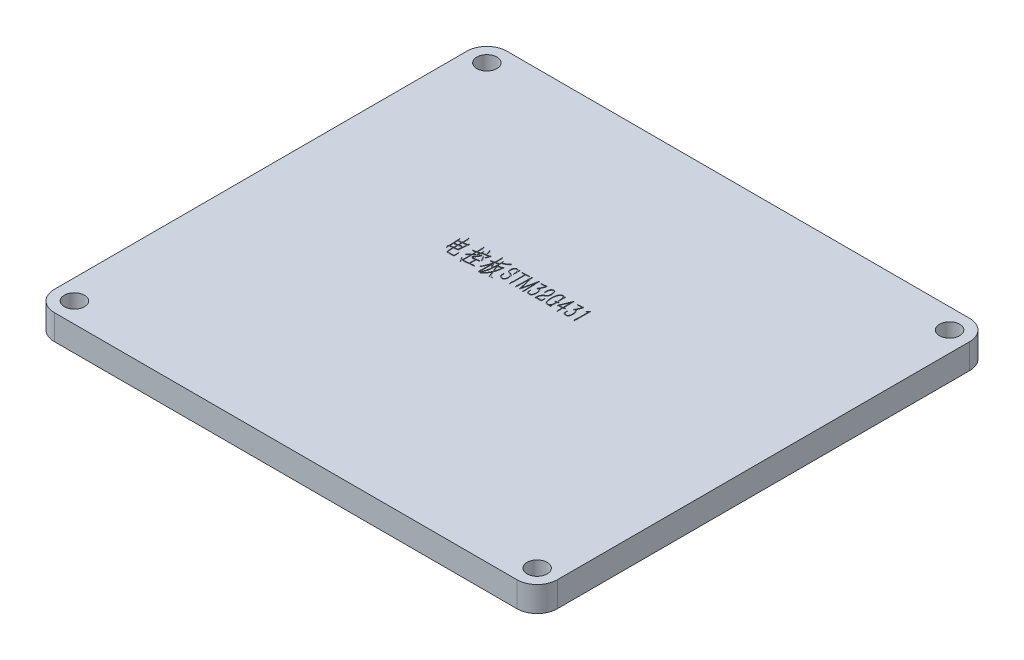
from build123d import *

# Parameters (mm, degrees)
SKETCH_1_R          = 2
EXTRUDE_2_DEPTH     = 5
CUT_EXTRUDE_1_DEPTH = 0.1


with BuildPart() as part:
    # 草图1 → 凸台-拉伸2 (new body)
    with BuildSketch(Plane(origin=(0, 0, 0), x_dir=(1, 0, 0), z_dir=(0, 1, 0))):
        with BuildLine():
            Line((4, 0), (96, 0))
            ThreePointArc((96, 0), (98.828427125, -1.171572875), (100, -4))
            Line((100, -4), (100, -86))
            ThreePointArc((100, -86), (98.828427125, -88.828427125), (96, -90))
            Line((96, -90), (4, -90))
            ThreePointArc((4, -90), (1.171572875, -88.828427125), (0, -86))
            Line((0, -86), (0, -4))
            ThreePointArc((0, -4), (1.171572875, -1.171572875), (4, 0))
        make_face()
        with Locations((4, -4)):
            Circle(SKETCH_1_R, mode=Mode.SUBTRACT)
        with Locations((96, -4)):
            Circle(SKETCH_1_R, mode=Mode.SUBTRACT)
        with Locations((96, -86)):
            Circle(SKETCH_1_R, mode=Mode.SUBTRACT)
        with Locations((4, -86)):
            Circle(SKETCH_1_R, mode=Mode.SUBTRACT)
    extrude(amount=EXTRUDE_2_DEPTH)

    # 草图3 → 切除-拉伸1 (cut)
    # profile 1 of 17: a face of its own
    with BuildSketch(Plane(origin=(0, 5, 0), x_dir=(1, 0, 0), z_dir=(0, 1, 0))):
        with BuildLine():
            Line((31.645496227, -36.949048597), (31.711125888, -37.195905618))
            Line((31.711125888, -37.195905618), (31.766314467, -37.412185184))
            Line((31.766314467, -37.412185184), (31.957237118, -37.39204881))
            Line((31.957237118, -37.39204881), (32.359964584, -37.342080773))
            Line((32.359964584, -37.342080773), (32.465866992, -37.3219444))
            Line((32.465866992, -37.3219444), (32.471087533, -36.858807813))
            add(Edge.make_bspline(
                [(32.471087533, -36.858807813), (32.471109477, -36.854829918), (32.47117807, -36.84239534), (32.470005838, -36.817050548), (32.469711287, -36.778253914), (32.467925031, -36.726800575), (32.466145945, -36.66410836), (32.461427774, -36.592003077), (32.454611671, -36.511455231), (32.446064852, -36.424082063), (32.434133624, -36.332759859), (32.415485482, -36.241305541), (32.390708619, -36.151219297), (32.370242286, -36.092523696), (32.359964584, -36.063048171)],
                knots=[0, 0, 0, 0, 0.177294891, 0.554209453, 1.130524385, 1.906506064, 2.848971625, 3.925876191, 5.126764862, 6.452083082, 7.83897123, 9.22979357, 10.608868701, 12, 12, 12, 12], degree=3))
            Line((32.359964584, -36.063048171), (32.405457872, -35.99294376))
            Line((32.405457872, -35.99294376), (32.707503472, -36.335262107))
            add(Edge.make_bspline(
                [(32.707503472, -36.335262107), (32.692302251, -36.369754085), (32.662495321, -36.437386808), (32.636047002, -36.528042249), (32.623217568, -36.608669911), (32.617268487, -36.684448474), (32.612629873, -36.776216858), (32.612248424, -36.842889437), (32.612042147, -36.878944187)],
                knots=[0, 0, 0, 0, 1.215957117, 2.384278755, 3.034624226, 3.848266097, 4.836399765, 6, 6, 6, 6], degree=3))
            Line((32.612042147, -36.878944187), (32.612042147, -37.301808026))
            Line((32.612042147, -37.301808026), (32.858899168, -37.271230571))
            Line((32.858899168, -37.271230571), (33.24596501, -37.216041992))
            Line((33.24596501, -37.216041992), (33.342172127, -37.195905618))
            Line((33.342172127, -37.195905618), (33.42719237, -37.0198988))
            add(Edge.make_bspline(
                [(33.42719237, -37.0198988), (33.430949649, -37.011561824), (33.437324924, -36.997415813), (33.447784522, -36.980995836), (33.453912526, -36.969787533), (33.463027422, -36.965593014), (33.471303206, -36.971867303), (33.481690567, -36.980034921), (33.496803455, -36.992587499), (33.507133365, -37.003374771), (33.512958405, -37.009457717)],
                knots=[0, 0, 0, 0, 1.663720426, 2.822966936, 3.56700533, 3.954602535, 4.461796658, 5.269494342, 6.4602669, 8, 8, 8, 8], degree=3))
            Line((33.512958405, -37.009457717), (33.633776645, -37.145191789))
            add(Edge.make_bspline(
                [(33.633776645, -37.145191789), (33.639517965, -37.153116681), (33.649907647, -37.167457826), (33.663400056, -37.186900883), (33.669861033, -37.204161103), (33.671997197, -37.221391252), (33.66809452, -37.237865502), (33.662515021, -37.253310557), (33.652681802, -37.267125695), (33.640908166, -37.286243031), (33.623134405, -37.31369506), (33.598707192, -37.348529977), (33.573964393, -37.393563581), (33.554476079, -37.449836969), (33.537975139, -37.515443293), (33.531372941, -37.562993637), (33.527874237, -37.588192002)],
                knots=[0, 0, 0, 0, 0.847429402, 1.533536147, 2.036930199, 2.426382901, 3.016860564, 3.480069352, 3.837966044, 4.476237987, 5.424607541, 6.665143789, 8.156530738, 9.850434346, 11.801019622, 14, 14, 14, 14], degree=3))
            Line((33.527874237, -37.588192002), (33.472685658, -38.111737709))
            Line((33.472685658, -38.111737709), (33.407055997, -38.751626905))
            Line((33.407055997, -38.751626905), (33.386919624, -38.912717892))
            Line((33.386919624, -38.912717892), (33.483126741, -39.048451964))
            add(Edge.make_bspline(
                [(33.483126741, -39.048451964), (33.48967042, -39.059839785), (33.500495122, -39.078677777), (33.508108911, -39.105291358), (33.50060986, -39.126306441), (33.488972425, -39.128097685), (33.483126741, -39.128997457)],
                knots=[0, 0, 0, 0, 1.606901506, 2.658172752, 3.325977029, 4, 4, 4, 4], degree=3))
            Line((33.483126741, -39.128997457), (33.402581247, -39.134217999))
            Line((33.402581247, -39.134217999), (32.959581034, -39.174490745))
            Line((32.959581034, -39.174490745), (32.707503472, -39.204322409))
            Line((32.707503472, -39.204322409), (32.601601064, -39.219238242))
            Line((32.601601064, -39.219238242), (32.601601064, -39.762920321))
            add(Edge.make_bspline(
                [(32.601601064, -39.762920321), (32.602531482, -39.81811926), (32.604332409, -39.924962846), (32.614261093, -40.055651469), (32.630379192, -40.152124842), (32.649339223, -40.216532256), (32.677218698, -40.272740656), (32.704649511, -40.317614823), (32.7410754, -40.34658955), (32.782444263, -40.364086948), (32.837043278, -40.379545818), (32.905797055, -40.391529822), (32.988719259, -40.400992458), (33.085550408, -40.407130587), (33.196448011, -40.411870207), (33.275044448, -40.412284584), (33.316815213, -40.412504809)],
                knots=[0, 0, 0, 0, 1.931152807, 3.737957541, 4.577172512, 5.350113142, 6.073531508, 6.773090527, 7.162848559, 7.680298175, 8.332476513, 9.14602524, 10.117846342, 11.250994603, 12.539017008, 14, 14, 14, 14], degree=3))
            add(Edge.make_bspline(
                [(33.316815213, -40.412504809), (33.355845661, -40.412656372), (33.429191233, -40.412941189), (33.53191316, -40.411091122), (33.620012053, -40.405996601), (33.693360688, -40.398665262), (33.752647503, -40.389996701), (33.796683823, -40.377460348), (33.829019031, -40.364203428), (33.857822836, -40.326821393), (33.870694647, -40.263321379), (33.877301368, -40.208805915), (33.880633666, -40.181309411)],
                knots=[0, 0, 0, 0, 1.652015129, 3.104447941, 4.3482727, 5.384821521, 6.227270062, 6.873348196, 7.334536251, 7.663266203, 8.821398446, 10, 10, 10, 10], degree=3))
            Line((33.880633666, -40.181309411), (33.880633666, -39.903874934))
            Line((33.880633666, -39.903874934), (33.880633666, -39.466095263))
            Line((33.880633666, -39.466095263), (33.941042786, -39.456399972))
            Line((33.941042786, -39.456399972), (33.950738077, -39.577218212))
            Line((33.950738077, -39.577218212), (33.976094991, -39.783056695))
            Line((33.976094991, -39.783056695), (34.011147197, -40.05527063))
            Line((34.011147197, -40.05527063), (34.046945194, -40.286466028))
            Line((34.046945194, -40.286466028), (34.071556317, -40.452777555))
            add(Edge.make_bspline(
                [(34.071556317, -40.452777555), (34.074184214, -40.466766069), (34.078408586, -40.489252751), (34.079913311, -40.519290917), (34.066877462, -40.539145951), (34.054166918, -40.544944392), (34.046945194, -40.548238881)],
                knots=[0, 0, 0, 0, 1.559608042, 2.507086382, 3.151774227, 4, 4, 4, 4], degree=3))
            Line((34.046945194, -40.548238881), (34.006672447, -40.563900504))
            add(Edge.make_bspline(
                [(34.006672447, -40.563900504), (34.001981474, -40.565743316), (33.990828593, -40.570124636), (33.970399704, -40.574735109), (33.944431357, -40.581038805), (33.912203909, -40.586537984), (33.874272572, -40.593598708), (33.830398119, -40.599830915), (33.780778278, -40.607721848), (33.669922361, -40.622153728), (33.502970477, -40.638992013), (33.354152777, -40.639149063), (33.281763007, -40.639225457)],
                knots=[0, 0, 0, 0, 0.206618915, 0.491240576, 0.857597671, 1.30390666, 1.832361082, 2.441372039, 3.122534554, 3.89462094, 7.030145068, 10, 10, 10, 10], degree=3))
            add(Edge.make_bspline(
                [(33.281763007, -40.639225457), (33.241734205, -40.638971523), (33.165874945, -40.638490289), (33.058415938, -40.634092905), (32.96335178, -40.626869019), (32.880425133, -40.616697595), (32.809293259, -40.603651036), (32.750263154, -40.587645942), (32.702875716, -40.569198337), (32.658341533, -40.538860386), (32.617446212, -40.497390556), (32.575675091, -40.448988676), (32.542805888, -40.400488595), (32.512060935, -40.33250034), (32.488556431, -40.237903103), (32.468828265, -40.114093158), (32.458312315, -39.977387551), (32.456898154, -39.882509327), (32.456171701, -39.833770524)],
                knots=[0, 0, 0, 0, 1.375107078, 2.605988713, 3.693973982, 4.649466436, 5.475237603, 6.17560074, 6.749778481, 7.211670088, 8.015056038, 8.742243092, 9.407844955, 10.019243034, 11.295622579, 12.740386124, 14.325541172, 16, 16, 16, 16], degree=3))
            Line((32.456171701, -39.833770524), (32.456171701, -39.239374615))
            Line((32.456171701, -39.239374615), (32.304776005, -39.255036239))
            Line((32.304776005, -39.255036239), (31.942321286, -39.310224817))
            Line((31.942321286, -39.310224817), (31.811807755, -39.330361191))
            Line((31.811807755, -39.330361191), (31.806587214, -39.557081838))
            Line((31.806587214, -39.557081838), (31.801366672, -39.687595369))
            add(Edge.make_bspline(
                [(31.801366672, -39.687595369), (31.800635842, -39.707231601), (31.799239393, -39.744751961), (31.787882044, -39.78223214), (31.777552855, -39.814045776), (31.75687884, -39.810138716), (31.744787403, -39.787786065), (31.736494282, -39.769795549), (31.731262262, -39.758445572)],
                knots=[0, 0, 0, 0, 1.721263003, 3.288940973, 3.839377096, 4.198736227, 4.863606649, 6, 6, 6, 6], degree=3))
            Line((31.731262262, -39.758445572), (31.655191518, -39.586913503))
            Line((31.655191518, -39.586913503), (31.60522348, -39.476536345))
            add(Edge.make_bspline(
                [(31.60522348, -39.476536345), (31.600319516, -39.465169253), (31.59253213, -39.447118565), (31.580035864, -39.424330934), (31.585353113, -39.403796036), (31.592724832, -39.378994349), (31.607451056, -39.343125681), (31.618897184, -39.315424353), (31.625359854, -39.299783735)],
                knots=[0, 0, 0, 0, 1.195724136, 1.898783123, 2.330290027, 3.145663464, 4.388395428, 6, 6, 6, 6], degree=3))
            add(Edge.make_bspline(
                [(31.625359854, -39.299783735), (31.629376556, -39.290432362), (31.637947922, -39.270477176), (31.645494205, -39.235908867), (31.651802237, -39.196097643), (31.653387028, -39.136434058), (31.655089463, -39.06337634), (31.65702232, -38.98355397), (31.659774755, -38.919445728), (31.660226972, -38.88239076), (31.660412059, -38.867224604)],
                knots=[0, 0, 0, 0, 0.558699634, 1.192226558, 1.938775613, 2.774002823, 4.470288396, 5.961506424, 7.165668957, 8, 8, 8, 8], degree=3))
            Line((31.660412059, -38.867224604), (31.655191518, -38.489854052))
            Line((31.655191518, -38.489854052), (31.640275686, -38.016276383))
            add(Edge.make_bspline(
                [(31.640275686, -38.016276383), (31.640319386, -38.010309351), (31.640423202, -37.996133884), (31.63934075, -37.972030401), (31.638891107, -37.941934962), (31.637271155, -37.906135688), (31.634843053, -37.864145948), (31.632688644, -37.816160984), (31.630626262, -37.76219674), (31.626594726, -37.685641782), (31.621904765, -37.594655912), (31.617164671, -37.49740752), (31.611399286, -37.419663076), (31.607796394, -37.353950856), (31.601433693, -37.286896183), (31.59455849, -37.204258436), (31.582531951, -37.099481859), (31.574556243, -37.022145073), (31.570171275, -36.979626053)],
                knots=[0, 0, 0, 0, 0.275532466, 0.654563513, 1.113927774, 1.665470852, 2.30930182, 3.056329963, 3.883644582, 4.803233469, 6.596547928, 8.091177521, 9.299307877, 10.196626331, 11.130014446, 12.409513054, 14.025984863, 16, 16, 16, 16], degree=3))
            Line((31.570171275, -36.979626053), (31.645496227, -36.949048597))
        make_face()
        with BuildLine():
            Line((31.811807755, -39.123776916), (32.456171701, -39.048451964))
            Line((32.456171701, -39.048451964), (32.460646451, -38.348899439))
            Line((32.460646451, -38.348899439), (32.324912379, -38.378731103))
            Line((32.324912379, -38.378731103), (32.169041933, -38.41900385))
            Line((32.169041933, -38.41900385), (32.02808732, -38.469717679))
            Line((32.02808732, -38.469717679), (31.993035115, -38.41900385))
            Line((31.993035115, -38.41900385), (31.90726908, -38.308626692))
            add(Edge.make_bspline(
                [(31.90726908, -38.308626692), (31.902028067, -38.302841002), (31.893021441, -38.292898352), (31.886914396, -38.273907639), (31.896208937, -38.257940009), (31.906846965, -38.254511096), (31.912489622, -38.252692322)],
                knots=[0, 0, 0, 0, 1.284117706, 2.206742812, 3.048814964, 4, 4, 4, 4], degree=3))
            Line((31.912489622, -38.252692322), (32.08849644, -38.228081199))
            Line((32.08849644, -38.228081199), (32.295080715, -38.202724285))
            Line((32.295080715, -38.202724285), (32.460646451, -38.172146829))
            Line((32.460646451, -38.172146829), (32.465866992, -37.518087592))
            Line((32.465866992, -37.518087592), (32.315217088, -37.543444506))
            Line((32.315217088, -37.543444506), (31.977373491, -37.588192002))
            Line((31.977373491, -37.588192002), (31.771535008, -37.623989999))
            Line((31.771535008, -37.623989999), (31.781230299, -38.016276383))
            Line((31.781230299, -38.016276383), (31.811807755, -39.123776916))
        make_face(mode=Mode.SUBTRACT)
        with BuildLine():
            Line((32.601601064, -39.028315591), (32.964055784, -38.988042844))
            Line((32.964055784, -38.988042844), (33.135587853, -38.957465388))
            Line((33.135587853, -38.957465388), (33.23626972, -38.937329015))
            Line((33.23626972, -38.937329015), (33.261626634, -38.695692535))
            Line((33.261626634, -38.695692535), (33.301899381, -38.288490319))
            Line((33.301899381, -38.288490319), (33.351867418, -37.673958037))
            Line((33.351867418, -37.673958037), (33.377224333, -37.406964643))
            Line((33.377224333, -37.406964643), (33.140808394, -37.432321557))
            Line((33.140808394, -37.432321557), (32.606821605, -37.50317176))
            Line((32.606821605, -37.50317176), (32.601601064, -38.142315165))
            add(Edge.make_bspline(
                [(32.601601064, -38.142315165), (32.649473726, -38.130894942), (32.738517835, -38.109653101), (32.860029578, -38.072797987), (32.961102165, -38.037945196), (33.018724851, -38.009095463), (33.044601277, -37.99614001)],
                knots=[0, 0, 0, 0, 1.262396956, 2.348083582, 3.25817942, 4, 4, 4, 4], degree=3))
            Line((33.044601277, -37.99614001), (33.181081141, -38.162451538))
            add(Edge.make_bspline(
                [(33.181081141, -38.162451538), (33.187673518, -38.172774205), (33.199019726, -38.190540653), (33.206480709, -38.217671155), (33.196746054, -38.240350151), (33.183052079, -38.242085632), (33.1758606, -38.242997031)],
                knots=[0, 0, 0, 0, 1.442479735, 2.482666664, 3.203162602, 4, 4, 4, 4], degree=3))
            Line((33.1758606, -38.242997031), (33.105010397, -38.248217572))
            Line((33.105010397, -38.248217572), (32.939444661, -38.268353946))
            Line((32.939444661, -38.268353946), (32.778353674, -38.288490319))
            Line((32.778353674, -38.288490319), (32.601601064, -38.323542524))
            Line((32.601601064, -38.323542524), (32.601601064, -39.028315591))
        make_face(mode=Mode.SUBTRACT)
    # profile 2 of 17: a face of its own
    with BuildSketch(Plane(origin=(0, 5, 0), x_dir=(1, 0, 0), z_dir=(0, 1, 0))):
        with BuildLine():
            Line((35.484085616, -38.449581306), (35.489306157, -37.688873869))
            add(Edge.make_bspline(
                [(35.489306157, -37.688873869), (35.460694539, -37.695741883), (35.406109101, -37.708844726), (35.329065948, -37.728858998), (35.260763726, -37.747754503), (35.201379469, -37.764424196), (35.151021588, -37.780651147), (35.110024085, -37.796756926), (35.076900284, -37.809750015), (35.059130278, -37.82067775), (35.051526485, -37.825353733)],
                knots=[0, 0, 0, 0, 1.535677867, 2.929776579, 4.15421769, 5.234237789, 6.14920554, 6.913060383, 7.534898092, 8, 8, 8, 8], degree=3))
            Line((35.051526485, -37.825353733), (34.879994416, -37.684399119))
            add(Edge.make_bspline(
                [(34.879994416, -37.684399119), (34.87500309, -37.680671903), (34.866389208, -37.674239584), (34.858404607, -37.663110287), (34.855395037, -37.651776247), (34.86479145, -37.640480548), (34.878431105, -37.630902432), (34.89640205, -37.625881879), (34.91533794, -37.624698264), (34.939077633, -37.620944227), (34.973014879, -37.618737914), (35.035067396, -37.612164194), (35.128214637, -37.59886061), (35.205754308, -37.582253449), (35.247669677, -37.57327617)],
                knots=[0, 0, 0, 0, 0.499104894, 0.861340324, 1.10578473, 1.36776809, 1.95872702, 2.46105718, 2.84493735, 3.492923787, 4.400683174, 5.592296716, 8.536208612, 12, 12, 12, 12], degree=3))
            Line((35.247669677, -37.57327617), (35.489306157, -37.523308133))
            Line((35.489306157, -37.523308133), (35.489306157, -37.104919043))
            add(Edge.make_bspline(
                [(35.489306157, -37.104919043), (35.489385571, -37.063154448), (35.489537785, -36.983104835), (35.488500402, -36.868254691), (35.488034292, -36.764088009), (35.486579704, -36.670358907), (35.484215387, -36.586336265), (35.481820347, -36.51093748), (35.476492694, -36.444042229), (35.469573311, -36.382054056), (35.458955896, -36.317932146), (35.444709593, -36.244341446), (35.425973127, -36.157829552), (35.411359456, -36.096085532), (35.403540122, -36.063048171)],
                knots=[0, 0, 0, 0, 1.432832556, 2.746290089, 3.940347678, 5.006579781, 5.962144097, 6.824224664, 7.594131752, 8.263789194, 8.9634599, 9.823216967, 10.835269155, 12, 12, 12, 12], degree=3))
            Line((35.403540122, -36.063048171), (35.443812869, -36.007859592))
            Line((35.443812869, -36.007859592), (35.701110972, -36.350177939))
            add(Edge.make_bspline(
                [(35.701110972, -36.350177939), (35.687615116, -36.376590479), (35.661467316, -36.427763952), (35.643002552, -36.500983278), (35.635838519, -36.570800562), (35.63209295, -36.646239896), (35.627195048, -36.744654361), (35.625805289, -36.818278065), (35.625040229, -36.858807813)],
                knots=[0, 0, 0, 0, 1.023906658, 1.983787222, 2.589941667, 3.451823516, 4.597232355, 6, 6, 6, 6], degree=3))
            Line((35.625040229, -36.858807813), (35.615344938, -37.497951218))
            add(Edge.make_bspline(
                [(35.615344938, -37.497951218), (35.654261999, -37.489256806), (35.726589219, -37.473098271), (35.824837808, -37.443482376), (35.906236063, -37.416120787), (35.952142408, -37.392755389), (35.972579117, -37.38235352)],
                knots=[0, 0, 0, 0, 1.270098254, 2.360473089, 3.270111062, 4, 4, 4, 4], degree=3))
            Line((35.972579117, -37.38235352), (36.123974812, -37.538223965))
            add(Edge.make_bspline(
                [(36.123974812, -37.538223965), (36.128886311, -37.515839413), (36.138813369, -37.470596041), (36.152558809, -37.412470948), (36.160872461, -37.360784246), (36.168339371, -37.314199175), (36.171705032, -37.260033481), (36.176289226, -37.201651888), (36.179883685, -37.145464814), (36.181932948, -37.097960189), (36.183587204, -37.062416209), (36.184154285, -37.04277044), (36.184383932, -37.034814632)],
                knots=[0, 0, 0, 0, 1.352825796, 2.734314336, 3.52314055, 4.442429931, 5.517204238, 6.72364433, 7.8998113, 8.839943642, 9.530220192, 10, 10, 10, 10], degree=3))
            Line((36.184383932, -37.034814632), (36.17394285, -36.83867144))
            Line((36.17394285, -36.83867144), (36.229131428, -36.823009816))
            add(Edge.make_bspline(
                [(36.229131428, -36.823009816), (36.23292822, -36.845621957), (36.239973851, -36.887582865), (36.248714734, -36.945534694), (36.256041169, -36.993422198), (36.258584233, -37.022122249), (36.259708884, -37.034814632)],
                knots=[0, 0, 0, 0, 1.285318317, 2.385140081, 3.285840252, 4, 4, 4, 4], degree=3))
            Line((36.259708884, -37.034814632), (36.274624716, -37.195905618))
            Line((36.274624716, -37.195905618), (37.065163817, -37.075087379))
            Line((37.065163817, -37.075087379), (37.56857315, -36.979626053))
            Line((37.56857315, -36.979626053), (37.638677561, -36.858807813))
            add(Edge.make_bspline(
                [(37.638677561, -36.858807813), (37.64165096, -36.853253279), (37.646682944, -36.843853153), (37.655786982, -36.83297326), (37.667421614, -36.831522823), (37.671967107, -36.836129322), (37.674475558, -36.83867144)],
                knots=[0, 0, 0, 0, 1.505548557, 2.547890814, 3.19864668, 4, 4, 4, 4], degree=3))
            Line((37.674475558, -36.83867144), (37.830346003, -37.049730464))
            add(Edge.make_bspline(
                [(37.830346003, -37.049730464), (37.835996158, -37.058401139), (37.845208177, -37.072537818), (37.849011721, -37.088898015), (37.850482377, -37.095223752)],
                knots=[0, 0, 0, 0, 1.226691941, 2, 2, 2, 2], degree=3))
            add(Edge.make_bspline(
                [(37.850482377, -37.095223752), (37.848529554, -37.102951835), (37.844760502, -37.117867452), (37.83503333, -37.12976386), (37.830346003, -37.135496498)],
                knots=[0, 0, 0, 0, 1.036240565, 2, 2, 2, 2], degree=3))
            Line((37.830346003, -37.135496498), (37.779632174, -37.180989786))
            add(Edge.make_bspline(
                [(37.779632174, -37.180989786), (37.772321363, -37.188100221), (37.756541819, -37.203447274), (37.733354165, -37.230458262), (37.709907983, -37.263598664), (37.684428164, -37.301429681), (37.658376793, -37.345166631), (37.630885157, -37.394084494), (37.602505872, -37.448913895), (37.583657027, -37.487470421), (37.573793691, -37.507646509)],
                knots=[0, 0, 0, 0, 0.630638202, 1.361159797, 2.197750695, 3.14026484, 4.18192561, 5.345395169, 6.610882545, 8, 8, 8, 8], degree=3))
            Line((37.573793691, -37.507646509), (37.488027657, -37.684399119))
            Line((37.488027657, -37.684399119), (37.427618537, -37.81491265))
            Line((37.427618537, -37.81491265), (37.367209417, -37.764944613))
            add(Edge.make_bspline(
                [(37.367209417, -37.764944613), (37.378359084, -37.730377473), (37.399789342, -37.663937581), (37.431126498, -37.56881046), (37.459595382, -37.482091977), (37.484839806, -37.403995567), (37.507171986, -37.334623781), (37.526825998, -37.274049727), (37.542854854, -37.221892406), (37.553361271, -37.190172673), (37.558132068, -37.175769245)],
                knots=[0, 0, 0, 0, 1.40745845, 2.705210477, 3.881110677, 4.944320063, 5.885681226, 6.705195678, 7.4120499, 8, 8, 8, 8], degree=3))
            Line((37.558132068, -37.175769245), (36.873495375, -37.271230571))
            Line((36.873495375, -37.271230571), (36.274624716, -37.366691896))
            add(Edge.make_bspline(
                [(36.274624716, -37.366691896), (36.271901122, -37.394784148), (36.26684058, -37.446980627), (36.25982089, -37.517783181), (36.256105207, -37.573085154), (36.251995951, -37.611059718), (36.249065815, -37.641744389), (36.243103817, -37.67567269), (36.235965358, -37.723197434), (36.223013007, -37.805444972), (36.202518496, -37.918559402), (36.178259441, -38.020892978), (36.161128279, -38.085322079), (36.152321137, -38.108398956), (36.143591051, -38.123555541), (36.131717258, -38.131422996), (36.11881476, -38.126731217), (36.108665227, -38.113552539), (36.09773712, -38.093348641), (36.091645668, -38.076554082), (36.088176815, -38.066990213)],
                knots=[0, 0, 0, 0, 1.765144369, 3.279705751, 4.449475404, 5.23071539, 5.668530118, 6.376570698, 7.383668185, 8.67446508, 11.583589077, 14.570321921, 15.24943635, 15.751783592, 16.109708323, 16.33926082, 16.565632296, 16.884635335, 17.364841753, 18, 18, 18, 18], degree=3))
            Line((36.088176815, -38.066990213), (36.023292946, -37.890237602))
            add(Edge.make_bspline(
                [(36.023292946, -37.890237602), (36.019999891, -37.882875855), (36.014060904, -37.869599028), (36.010259243, -37.851061118), (36.004860825, -37.838085652), (36.005136728, -37.826443087), (36.007758593, -37.816205608), (36.009163623, -37.805574308), (36.014532401, -37.795077495), (36.022218129, -37.781574053), (36.033142617, -37.762088901), (36.049202759, -37.737957412), (36.067506976, -37.707886298), (36.082975419, -37.670028186), (36.100066399, -37.626888506), (36.108869188, -37.595257682), (36.11353373, -37.578496712)],
                knots=[0, 0, 0, 0, 0.995315437, 1.795040006, 2.34089252, 2.710543393, 3.21200008, 3.653049669, 4.02525871, 4.659556822, 5.584197267, 6.789111698, 8.252556242, 9.93526866, 11.846124932, 14, 14, 14, 14], degree=3))
            add(Edge.make_bspline(
                [(36.11353373, -37.578496712), (36.090157068, -37.580650487), (36.048354537, -37.584501903), (35.993209819, -37.590652571), (35.95292546, -37.595025904), (35.931062108, -37.597627477), (35.922611079, -37.598633085)],
                knots=[0, 0, 0, 0, 1.467282915, 2.623819458, 3.468053099, 4, 4, 4, 4], degree=3))
            Line((35.922611079, -37.598633085), (35.806267589, -37.623989999))
            Line((35.806267589, -37.623989999), (35.615344938, -37.664262746))
            Line((35.615344938, -37.664262746), (35.615344938, -38.353374189))
            Line((35.615344938, -38.353374189), (35.967358575, -38.071464962))
            Line((35.967358575, -38.071464962), (35.997936031, -38.147535706))
            Line((35.997936031, -38.147535706), (35.615344938, -38.524906258))
            add(Edge.make_bspline(
                [(35.615344938, -38.524906258), (35.614804207, -38.56343826), (35.613757662, -38.638014186), (35.612949588, -38.746156638), (35.613149514, -38.846839702), (35.613083792, -38.940063558), (35.613158365, -39.02558106), (35.612949877, -39.103641736), (35.613614207, -39.174002453), (35.614792112, -39.218493574), (35.615344938, -39.239374615)],
                knots=[0, 0, 0, 0, 1.294409634, 2.505236972, 3.632532169, 4.676324017, 5.636612518, 6.505047336, 7.298373088, 8, 8, 8, 8], degree=3))
            Line((35.615344938, -39.239374615), (35.620565479, -39.597354585))
            Line((35.620565479, -39.597354585), (35.620565479, -39.954588764))
            add(Edge.make_bspline(
                [(35.620565479, -39.954588764), (35.620744211, -39.993868741), (35.62107228, -40.065968668), (35.619063513, -40.163906312), (35.618113576, -40.241989532), (35.616175713, -40.287214243), (35.615344938, -40.306602401)],
                knots=[0, 0, 0, 0, 1.33872197, 2.45727629, 3.338623297, 4, 4, 4, 4], degree=3))
            add(Edge.make_bspline(
                [(35.615344938, -40.306602401), (35.613531431, -40.34265923), (35.610102146, -40.410841586), (35.602537876, -40.507822877), (35.593940873, -40.593639198), (35.58371495, -40.667602702), (35.572970004, -40.727171468), (35.562255578, -40.772075428), (35.552107261, -40.799828012), (35.536534284, -40.82020738), (35.508271906, -40.808318005), (35.499759783, -40.790892763), (35.494526698, -40.78018007)],
                knots=[0, 0, 0, 0, 1.873634158, 3.542984536, 5.047602547, 6.350384444, 7.41321426, 8.198647921, 8.718743886, 8.992436488, 9.380569955, 10, 10, 10, 10], degree=3))
            Line((35.494526698, -40.78018007), (35.419201746, -40.65936183))
            Line((35.419201746, -40.65936183), (35.313299338, -40.483355011))
            add(Edge.make_bspline(
                [(35.313299338, -40.483355011), (35.296828527, -40.458536682), (35.264647946, -40.410046763), (35.233193367, -40.361082842), (35.217838013, -40.337179857)],
                knots=[0, 0, 0, 0, 1.023649052, 2, 2, 2, 2], degree=3))
            Line((35.217838013, -40.337179857), (35.051526485, -40.11567975))
            Line((35.051526485, -40.11567975), (34.980676282, -40.014997884))
            Line((34.980676282, -40.014997884), (35.006033197, -39.959809305))
            Line((35.006033197, -39.959809305), (35.348351544, -40.266329654))
            add(Edge.make_bspline(
                [(35.348351544, -40.266329654), (35.359665931, -40.276728593), (35.379210336, -40.294691657), (35.405755071, -40.31542857), (35.424123453, -40.329821303), (35.43553038, -40.33142424), (35.439338119, -40.331959315)],
                knots=[0, 0, 0, 0, 1.618726001, 2.796177461, 3.598152776, 4, 4, 4, 4], degree=3))
            add(Edge.make_bspline(
                [(35.439338119, -40.331959315), (35.440954731, -40.331075717), (35.445781166, -40.328437712), (35.448768934, -40.317155608), (35.453714352, -40.3020414), (35.457923131, -40.271756976), (35.463605295, -40.2295165), (35.463833753, -40.194028601), (35.463949242, -40.17608887)],
                knots=[0, 0, 0, 0, 0.200977806, 0.600024171, 1.208727418, 2.028900242, 3.992542255, 6, 6, 6, 6], degree=3))
            Line((35.463949242, -40.17608887), (35.469169783, -40.000082051))
            Line((35.469169783, -40.000082051), (35.479610866, -39.818854692))
            Line((35.479610866, -39.818854692), (35.479610866, -38.640503956))
            add(Edge.make_bspline(
                [(35.479610866, -38.640503956), (35.459978653, -38.658161802), (35.422417776, -38.691945267), (35.368397079, -38.740317137), (35.320439608, -38.785134378), (35.27688195, -38.824582058), (35.238940764, -38.859734432), (35.205755996, -38.890175344), (35.178669311, -38.917057698), (35.133571771, -38.959978584), (35.070098033, -39.02899068), (35.01850498, -39.094318754), (34.991117365, -39.128997457)],
                knots=[0, 0, 0, 0, 1.144702284, 2.190075181, 3.143401702, 3.990136952, 4.737569559, 5.385716918, 5.942066939, 6.391742088, 8.084595222, 10, 10, 10, 10], degree=3))
            Line((34.991117365, -39.128997457), (34.784533091, -39.02309505))
            add(Edge.make_bspline(
                [(34.784533091, -39.02309505), (34.780274965, -39.020517171), (34.771015755, -39.014911627), (34.768068475, -38.99582051), (34.775837405, -38.974712203), (34.78807419, -38.963683926), (34.794974173, -38.957465388)],
                knots=[0, 0, 0, 0, 0.717921946, 1.561107073, 2.624776204, 4, 4, 4, 4], degree=3))
            Line((34.794974173, -38.957465388), (34.855383293, -38.922413183))
            add(Edge.make_bspline(
                [(34.855383293, -38.922413183), (34.876337503, -38.908597817), (34.923953959, -38.877203708), (35.001630351, -38.822016483), (35.094393139, -38.75360152), (35.179798159, -38.689875086), (35.250207899, -38.635027149), (35.300387298, -38.597342124), (35.344448156, -38.562786927), (35.382960487, -38.532432656), (35.416086108, -38.506157442), (35.443691222, -38.483794564), (35.465853521, -38.465436037), (35.478632462, -38.454323398), (35.484085616, -38.449581306)],
                knots=[0, 0, 0, 0, 1.148047878, 2.608829933, 4.357911761, 6.420762664, 7.482979085, 8.440511335, 9.291273067, 10.044307945, 10.683663644, 11.225349556, 11.669433646, 12, 12, 12, 12], degree=3))
        make_face()
    # profile 3 of 17: a face of its own
    with BuildSketch(Plane(origin=(0, 5, 0), x_dir=(1, 0, 0), z_dir=(0, 1, 0))):
        with BuildLine():
            Line((36.728066012, -40.226056908), (36.742981844, -39.043231423))
            add(Edge.make_bspline(
                [(36.742981844, -39.043231423), (36.709653866, -39.048859643), (36.645937483, -39.059619667), (36.555064718, -39.076411655), (36.472813619, -39.090709013), (36.399887625, -39.105993871), (36.335769757, -39.119486504), (36.280323998, -39.130844467), (36.234235784, -39.142994571), (36.206499307, -39.150840882), (36.194079223, -39.154354372)],
                knots=[0, 0, 0, 0, 1.44776736, 2.767839694, 3.958379883, 5.023444348, 5.959060485, 6.76525928, 7.447096935, 8, 8, 8, 8], degree=3))
            Line((36.194079223, -39.154354372), (36.063565692, -39.013399759))
            add(Edge.make_bspline(
                [(36.063565692, -39.013399759), (36.059476049, -39.010366515), (36.052688188, -39.005332033), (36.044934566, -38.996502127), (36.044344412, -38.986478878), (36.04663822, -38.980758551), (36.047904069, -38.977601762)],
                knots=[0, 0, 0, 0, 1.400896141, 2.325162909, 3.075733232, 4, 4, 4, 4], degree=3))
            add(Edge.make_bspline(
                [(36.047904069, -38.977601762), (36.050569108, -38.975689672), (36.059688115, -38.969147045), (36.085103004, -38.968038196), (36.123601347, -38.961086406), (36.19587824, -38.957407154), (36.290030357, -38.947510243), (36.365164533, -38.934011522), (36.400663498, -38.927633724)],
                knots=[0, 0, 0, 0, 0.16324811, 0.558588586, 1.22794097, 2.157502851, 4.184519017, 6, 6, 6, 6], degree=3))
            Line((36.400663498, -38.927633724), (36.974177241, -38.836647148))
            add(Edge.make_bspline(
                [(36.974177241, -38.836647148), (37.009857236, -38.830527942), (37.077534664, -38.818921098), (37.171226475, -38.793462931), (37.25267323, -38.764667692), (37.299622911, -38.738556972), (37.321716129, -38.726269991)],
                knots=[0, 0, 0, 0, 1.183627368, 2.245091567, 3.174188747, 4, 4, 4, 4], degree=3))
            Line((37.321716129, -38.726269991), (37.457450201, -38.876919895))
            add(Edge.make_bspline(
                [(37.457450201, -38.876919895), (37.463629998, -38.884806193), (37.47492682, -38.899222541), (37.485607131, -38.916842032), (37.49036352, -38.931098272), (37.483183682, -38.939627021), (37.469658924, -38.94144436), (37.459139574, -38.942141214), (37.452975451, -38.942549556)],
                knots=[0, 0, 0, 0, 1.738041855, 3.177183541, 3.705788334, 4.140298798, 4.910253301, 6, 6, 6, 6], degree=3))
            Line((37.452975451, -38.942549556), (37.361988876, -38.952990639))
            add(Edge.make_bspline(
                [(37.361988876, -38.952990639), (37.345596045, -38.955354814), (37.316321177, -38.959576839), (37.277950213, -38.963501863), (37.25093002, -38.967222553), (37.236701046, -38.967722764), (37.231475345, -38.967906471)],
                knots=[0, 0, 0, 0, 1.512153757, 2.700454913, 3.522731938, 4, 4, 4, 4], degree=3))
            Line((37.231475345, -38.967906471), (37.065163817, -38.997738135))
            Line((37.065163817, -38.997738135), (36.883936457, -39.02309505))
            Line((36.883936457, -39.02309505), (36.858579543, -40.221582158))
            Line((36.858579543, -40.221582158), (37.251611718, -40.17608887))
            add(Edge.make_bspline(
                [(37.251611718, -40.17608887), (37.295208717, -40.170931547), (37.375525135, -40.161430486), (37.484574519, -40.140538322), (37.573140016, -40.117967567), (37.622247811, -40.095158286), (37.643898102, -40.085102294)],
                knots=[0, 0, 0, 0, 1.301216367, 2.397161334, 3.293352051, 4, 4, 4, 4], degree=3))
            Line((37.643898102, -40.085102294), (37.779632174, -40.246193281))
            add(Edge.make_bspline(
                [(37.779632174, -40.246193281), (37.787948138, -40.257915121), (37.801999183, -40.277720897), (37.810553791, -40.308023547), (37.799897693, -40.334666153), (37.783803183, -40.33290525), (37.775157425, -40.331959315)],
                knots=[0, 0, 0, 0, 1.482164595, 2.504335462, 3.196548733, 4, 4, 4, 4], degree=3))
            Line((37.775157425, -40.331959315), (37.658813934, -40.326738774))
            add(Edge.make_bspline(
                [(37.658813934, -40.326738774), (37.642156539, -40.326625002), (37.603856535, -40.326363407), (37.539197906, -40.328969548), (37.459928395, -40.333782568), (37.365881992, -40.33926376), (37.257335732, -40.348951425), (37.133932916, -40.358779571), (36.996309856, -40.372818327), (36.899601784, -40.382218219), (36.848884252, -40.387147894)],
                knots=[0, 0, 0, 0, 0.492008554, 1.131265053, 1.910912644, 2.83804558, 3.913798937, 5.129815514, 6.494761897, 8, 8, 8, 8], degree=3))
            Line((36.848884252, -40.387147894), (36.466293159, -40.427420641))
            add(Edge.make_bspline(
                [(36.466293159, -40.427420641), (36.409318254, -40.434029566), (36.301629384, -40.446521167), (36.150611238, -40.46943149), (36.019392086, -40.494245805), (35.939438851, -40.514338474), (35.902474706, -40.523627758)],
                knots=[0, 0, 0, 0, 1.202188218, 2.272268675, 3.201231664, 4, 4, 4, 4], degree=3))
            Line((35.902474706, -40.523627758), (35.765994842, -40.372232062))
            add(Edge.make_bspline(
                [(35.765994842, -40.372232062), (35.761122472, -40.366820727), (35.752557235, -40.357308033), (35.745833154, -40.340282988), (35.749441054, -40.323482408), (35.757249882, -40.315944824), (35.761520092, -40.311822942)],
                knots=[0, 0, 0, 0, 1.240317107, 2.180378589, 3.004951177, 4, 4, 4, 4], degree=3))
            add(Edge.make_bspline(
                [(35.761520092, -40.311822942), (35.767191553, -40.309642022), (35.783285491, -40.303453211), (35.808605919, -40.310012089), (35.837493897, -40.312113221), (35.868219233, -40.313173299), (35.90548875, -40.310179908), (35.932558044, -40.307859453), (35.947222202, -40.306602401)],
                knots=[0, 0, 0, 0, 0.575440863, 1.632931878, 2.402216304, 3.383850717, 4.582762173, 6, 6, 6, 6], degree=3))
            add(Edge.make_bspline(
                [(35.947222202, -40.306602401), (35.971341499, -40.305189256), (36.016360879, -40.302551579), (36.079213694, -40.297718448), (36.13295968, -40.294373167), (36.177416326, -40.290393453), (36.212497763, -40.287636345), (36.238043649, -40.284977731), (36.254599897, -40.284251771), (36.262450045, -40.282533861), (36.264929425, -40.281991278)],
                knots=[0, 0, 0, 0, 1.819220617, 3.395629057, 4.746648399, 5.873685969, 6.756662978, 7.395584255, 7.809102141, 8, 8, 8, 8], degree=3))
            Line((36.264929425, -40.281991278), (36.728066012, -40.226056908))
        make_face()
    # profile 4 of 17: a face of its own
    with BuildSketch(Plane(origin=(0, 5, 0), x_dir=(1, 0, 0), z_dir=(0, 1, 0))):
        with BuildLine():
            add(Edge.make_bspline(
                [(35.886813082, -38.852308772), (35.923851373, -38.806012616), (35.993504648, -38.718949235), (36.08762724, -38.593869456), (36.165416338, -38.482644962), (36.209044924, -38.411490473), (36.229131428, -38.378731103)],
                knots=[0, 0, 0, 0, 1.216483877, 2.287688858, 3.211655737, 4, 4, 4, 4], degree=3))
            Line((36.229131428, -38.378731103), (36.305202172, -38.23777649))
            Line((36.305202172, -38.23777649), (36.400663498, -38.081906045))
            add(Edge.make_bspline(
                [(36.400663498, -38.081906045), (36.421077689, -38.044144908), (36.460821235, -37.970629314), (36.501949565, -37.877263526), (36.525948139, -37.807620071), (36.542126354, -37.766001044), (36.550852552, -37.732308242), (36.554853342, -37.712750895), (36.556533943, -37.704535493)],
                knots=[0, 0, 0, 0, 1.885916253, 3.671612379, 4.473256984, 5.122795379, 5.631514986, 6, 6, 6, 6], degree=3))
            Line((36.556533943, -37.704535493), (36.576670316, -37.593412544))
            Line((36.576670316, -37.593412544), (36.622163604, -37.57327617))
            Line((36.622163604, -37.57327617), (36.737761303, -37.93573089))
            add(Edge.make_bspline(
                [(36.737761303, -37.93573089), (36.71387694, -37.948813099), (36.665683405, -37.975210198), (36.621041378, -38.020808909), (36.593299568, -38.057331828), (36.575264009, -38.082288923), (36.553807481, -38.112563721), (36.529099512, -38.148718597), (36.500886129, -38.190152675), (36.469481424, -38.237498963), (36.434503291, -38.290087747), (36.396881115, -38.348195775), (36.355331455, -38.410366291), (36.308063963, -38.474905374), (36.256893105, -38.542966955), (36.200056439, -38.612795146), (36.138640393, -38.685177657), (36.073226752, -38.760686224), (36.002082713, -38.838264461), (35.952524016, -38.890420998), (35.927085829, -38.917192642)],
                knots=[0, 0, 0, 0, 1.143566675, 2.30747285, 2.651371637, 3.079162622, 3.605661014, 4.216344869, 4.925852789, 5.719660803, 6.61233609, 7.589369512, 8.639073142, 9.765206377, 10.962488799, 12.229788524, 13.561413939, 14.965831463, 16.442579108, 18, 18, 18, 18], degree=3))
            Line((35.927085829, -38.917192642), (35.886813082, -38.852308772))
        make_face()
    # profile 5 of 17: a face of its own
    with BuildSketch(Plane(origin=(0, 5, 0), x_dir=(1, 0, 0), z_dir=(0, 1, 0))):
        with BuildLine():
            Line((36.616943063, -36.042911798), (36.657215809, -35.987723219))
            Line((36.657215809, -35.987723219), (36.722845471, -36.068268712))
            Line((36.722845471, -36.068268712), (36.818306796, -36.204002784))
            Line((36.818306796, -36.204002784), (36.893631748, -36.304684651))
            Line((36.893631748, -36.304684651), (36.984618324, -36.460555096))
            add(Edge.make_bspline(
                [(36.984618324, -36.460555096), (36.990254462, -36.470483238), (37.001029482, -36.489463598), (37.00548377, -36.517368517), (37.004070564, -36.541917609), (37.000764501, -36.566243707), (36.996448778, -36.59713917), (36.992186447, -36.619675008), (36.989838865, -36.632087165)],
                knots=[0, 0, 0, 0, 1.156281598, 2.210548629, 2.819405877, 3.661981156, 4.712279599, 6, 6, 6, 6], degree=3))
            Line((36.989838865, -36.632087165), (36.933904495, -36.84314619))
            add(Edge.make_bspline(
                [(36.933904495, -36.84314619), (36.930144468, -36.856392257), (36.923672877, -36.879190798), (36.913062966, -36.907180884), (36.902899994, -36.924491999), (36.889156477, -36.930986484), (36.878714036, -36.923293934), (36.871626804, -36.911682632), (36.866672545, -36.894360368), (36.864841174, -36.881203188), (36.863800084, -36.873723645)],
                knots=[0, 0, 0, 0, 2.007938573, 3.455974515, 4.362698683, 4.901875636, 5.405740225, 6.059588322, 6.896922441, 8, 8, 8, 8], degree=3))
            Line((36.863800084, -36.873723645), (36.843663711, -36.78273707))
            Line((36.843663711, -36.78273707), (36.828747878, -36.687275744))
            add(Edge.make_bspline(
                [(36.828747878, -36.687275744), (36.822294302, -36.658622754), (36.808974178, -36.599483239), (36.783250194, -36.509244805), (36.752514122, -36.414611413), (36.718554707, -36.319103441), (36.685030953, -36.229461476), (36.657456702, -36.152362503), (36.634294086, -36.092334409), (36.622100468, -36.057602139), (36.616943063, -36.042911798)],
                knots=[0, 0, 0, 0, 1.038121707, 2.142673848, 3.315492523, 4.555155486, 5.725700072, 6.698770217, 7.449632592, 8, 8, 8, 8], degree=3))
        make_face()
    # profile 6 of 17: a face of its own
    with BuildSketch(Plane(origin=(0, 5, 0), x_dir=(1, 0, 0), z_dir=(0, 1, 0))):
        with BuildLine():
            add(Edge.make_bspline(
                [(37.014449988, -37.653821664), (37.083823556, -37.719180977), (37.224731948, -37.8519358), (37.359301663, -37.991113478), (37.427618537, -38.061769671)],
                knots=[0, 0, 0, 0, 0.984661984, 2, 2, 2, 2], degree=3))
            Line((37.427618537, -38.061769671), (37.56857315, -38.207944826))
            add(Edge.make_bspline(
                [(37.56857315, -38.207944826), (37.574356469, -38.216809156), (37.584377767, -38.23216921), (37.596157386, -38.25231362), (37.599734545, -38.272014418), (37.603073201, -38.294317058), (37.602664411, -38.326055175), (37.603277657, -38.350152525), (37.603625356, -38.363815271)],
                knots=[0, 0, 0, 0, 1.166414004, 2.021154594, 2.524609699, 3.350969205, 4.498049041, 6, 6, 6, 6], degree=3))
            Line((37.603625356, -38.363815271), (37.603625356, -38.580094836))
            add(Edge.make_bspline(
                [(37.603625356, -38.580094836), (37.603677679, -38.591063687), (37.603774389, -38.61133778), (37.599619855, -38.639096685), (37.594856013, -38.662742804), (37.588255722, -38.679407364), (37.576435018, -38.693046682), (37.560015368, -38.682670312), (37.547484072, -38.663539464), (37.538798789, -38.64596376), (37.533520945, -38.635283415)],
                knots=[0, 0, 0, 0, 1.396930573, 2.581993465, 3.590713621, 4.428679628, 4.969196196, 5.523515409, 6.495098186, 8, 8, 8, 8], degree=3))
            Line((37.533520945, -38.635283415), (37.493248198, -38.545042631))
            add(Edge.make_bspline(
                [(37.493248198, -38.545042631), (37.488514823, -38.536844658), (37.476488682, -38.516015971), (37.454796817, -38.477626503), (37.424908398, -38.425453147), (37.387684732, -38.360532595), (37.344590047, -38.285165447), (37.294417642, -38.203222172), (37.238432775, -38.115396731), (37.178947229, -38.024366466), (37.120896168, -37.935617225), (37.06665994, -37.855845903), (37.02068966, -37.786556027), (36.992332588, -37.744057266), (36.979397783, -37.724671866)],
                knots=[0, 0, 0, 0, 0.351905677, 0.894090934, 1.639164147, 2.58712722, 3.67609546, 4.866384336, 6.158509383, 7.547810839, 8.90885447, 10.100720838, 11.133662137, 12, 12, 12, 12], degree=3))
            Line((36.979397783, -37.724671866), (37.014449988, -37.653821664))
        make_face()
    # profile 7 of 17: a face of its own
    with BuildSketch(Plane(origin=(0, 5, 0), x_dir=(1, 0, 0), z_dir=(0, 1, 0))):
        with BuildLine():
            Line((39.116836521, -37.538223965), (39.127277604, -37.060171546))
            add(Edge.make_bspline(
                [(39.127277604, -37.060171546), (39.127280443, -37.024622092), (39.127285506, -36.961229708), (39.127256661, -36.8781988), (39.127322603, -36.818782794), (39.127187503, -36.777518269), (39.127591568, -36.742449053), (39.125384224, -36.702451038), (39.124379076, -36.651716178), (39.122088749, -36.594299269), (39.119707735, -36.53763147), (39.118886855, -36.489375861), (39.11638475, -36.453366465), (39.117275297, -36.425724739), (39.11512727, -36.398350275), (39.11124049, -36.363313239), (39.105388106, -36.316512001), (39.093146162, -36.23822989), (39.073045506, -36.131485533), (39.048653779, -36.045977905), (39.036291028, -36.002639051)],
                knots=[0, 0, 0, 0, 1.800612698, 3.210882783, 4.205626861, 4.810028326, 5.301104516, 5.981522364, 6.838128037, 7.871337983, 8.891964754, 9.710812417, 10.315738308, 10.718672618, 11.109826755, 11.704975957, 12.504623085, 13.498330597, 15.718365012, 18, 18, 18, 18], degree=3))
            Line((39.036291028, -36.002639051), (39.066868484, -35.947450473))
            Line((39.066868484, -35.947450473), (39.343557169, -36.259191363))
            add(Edge.make_bspline(
                [(39.343557169, -36.259191363), (39.331671884, -36.289779618), (39.310215247, -36.345000935), (39.289871134, -36.425034626), (39.279834234, -36.497428386), (39.271527542, -36.570510538), (39.268111786, -36.655223111), (39.263753873, -36.733499918), (39.260747089, -36.798388917), (39.259699641, -36.839431611), (39.257538355, -36.869976598), (39.257720075, -36.887146135), (39.257791134, -36.893860019)],
                knots=[0, 0, 0, 0, 1.526368013, 2.755569097, 3.832359308, 4.926173951, 6.177772594, 7.776628182, 8.575783774, 9.201047995, 9.687582094, 10, 10, 10, 10], degree=3))
            Line((39.257791134, -36.893860019), (39.257791134, -37.064646296))
            Line((39.257791134, -37.064646296), (39.252570593, -37.51286705))
            Line((39.252570593, -37.51286705), (39.363693542, -37.487510136))
            add(Edge.make_bspline(
                [(39.363693542, -37.487510136), (39.391455223, -37.480348998), (39.444536446, -37.466656673), (39.518053802, -37.438432359), (39.581891677, -37.404439028), (39.617871444, -37.375921416), (39.635161686, -37.362217146)],
                knots=[0, 0, 0, 0, 1.139013, 2.177829348, 3.124347542, 4, 4, 4, 4], degree=3))
            Line((39.635161686, -37.362217146), (39.77164155, -37.492730677))
            add(Edge.make_bspline(
                [(39.77164155, -37.492730677), (39.778728824, -37.50371088), (39.791438752, -37.523402173), (39.800202865, -37.551802733), (39.796642703, -37.581149885), (39.78011505, -37.582847109), (39.77164155, -37.583717253)],
                knots=[0, 0, 0, 0, 1.36381797, 2.445796335, 3.203181191, 4, 4, 4, 4], degree=3))
            Line((39.77164155, -37.583717253), (39.726148262, -37.588192002))
            add(Edge.make_bspline(
                [(39.726148262, -37.588192002), (39.720682063, -37.590435618), (39.705606748, -37.596623318), (39.683450557, -37.605468753), (39.656577788, -37.613888188), (39.626598355, -37.620252569), (39.588472206, -37.626749031), (39.541691693, -37.634201753), (39.485225596, -37.643181251), (39.417800646, -37.654314713), (39.339072478, -37.668684762), (39.282651519, -37.678934471), (39.252570593, -37.684399119)],
                knots=[0, 0, 0, 0, 0.366038895, 1.009504195, 1.477097703, 2.108471957, 2.905975091, 3.873075274, 5.042718153, 6.447779004, 8.10612765, 10, 10, 10, 10], degree=3))
            Line((39.252570593, -37.684399119), (39.248095844, -37.976003637))
            add(Edge.make_bspline(
                [(39.248095844, -37.976003637), (39.267513521, -37.991880943), (39.304155421, -38.021842029), (39.355298642, -38.064488103), (39.400553291, -38.100914893), (39.4381441, -38.132727643), (39.468965631, -38.159377123), (39.493627072, -38.179619489), (39.51089087, -38.19575997), (39.528678437, -38.21192709), (39.543797565, -38.228941891), (39.559674326, -38.235539573), (39.565057275, -38.23777649)],
                knots=[0, 0, 0, 0, 1.827759016, 3.449051256, 4.852371723, 6.060811609, 7.037357936, 7.821354094, 8.385551277, 8.757245742, 9.57864934, 10, 10, 10, 10], degree=3))
            Line((39.565057275, -38.23777649), (39.600109481, -38.268353946))
            add(Edge.make_bspline(
                [(39.600109481, -38.268353946), (39.611547828, -38.278509685), (39.63064788, -38.295468004), (39.653420085, -38.321387059), (39.665583185, -38.348855332), (39.667798974, -38.377471388), (39.669987819, -38.40132978), (39.670727171, -38.414775447), (39.670959683, -38.41900385)],
                knots=[0, 0, 0, 0, 1.576365025, 2.632255686, 3.526743448, 4.613245975, 5.563892569, 6, 6, 6, 6], degree=3))
            Line((39.670959683, -38.41900385), (39.65082331, -38.66064033))
            add(Edge.make_bspline(
                [(39.65082331, -38.66064033), (39.648941616, -38.67031583), (39.645313248, -38.688972567), (39.636360372, -38.707954446), (39.627764009, -38.722455575), (39.616553813, -38.720579084), (39.607955318, -38.710433024), (39.603084725, -38.701282322), (39.600109481, -38.695692535)],
                knots=[0, 0, 0, 0, 1.666049508, 3.212552139, 3.786526203, 4.215285616, 4.909791481, 6, 6, 6, 6], degree=3))
            Line((39.600109481, -38.695692535), (39.565057275, -38.630808666))
            Line((39.565057275, -38.630808666), (39.484511782, -38.474192429))
            add(Edge.make_bspline(
                [(39.484511782, -38.474192429), (39.468171401, -38.446061584), (39.433907091, -38.387073732), (39.378500992, -38.294907258), (39.316132773, -38.195425072), (39.271339372, -38.127070749), (39.248095844, -38.091601335)],
                knots=[0, 0, 0, 0, 0.867874761, 1.819855318, 2.868711588, 4, 4, 4, 4], degree=3))
            Line((39.248095844, -38.091601335), (39.242875302, -39.969504596))
            add(Edge.make_bspline(
                [(39.242875302, -39.969504596), (39.242145496, -39.99859083), (39.240779382, -40.053036924), (39.238635647, -40.129111676), (39.236190143, -40.193980594), (39.234277583, -40.262095104), (39.233280194, -40.331210831), (39.232362889, -40.391123716), (39.232442807, -40.429160866), (39.232432904, -40.449048591), (39.232434372, -40.462970041), (39.232434262, -40.47017936), (39.23243422, -40.472913929)],
                knots=[0, 0, 0, 0, 1.733428135, 3.244778637, 4.534080354, 5.600866198, 7.304360827, 8.652221101, 9.170597601, 9.570488043, 9.837081672, 10, 10, 10, 10], degree=3))
            Line((39.23243422, -40.472913929), (39.222738929, -40.639225457))
            add(Edge.make_bspline(
                [(39.222738929, -40.639225457), (39.220994243, -40.661353516), (39.218000133, -40.699328163), (39.208704981, -40.744559872), (39.198453695, -40.778019672), (39.182930762, -40.783422045), (39.177245641, -40.785400611)],
                knots=[0, 0, 0, 0, 1.643334809, 2.820177626, 3.567901744, 4, 4, 4, 4], degree=3))
            add(Edge.make_bspline(
                [(39.177245641, -40.785400611), (39.169122092, -40.783581876), (39.151054142, -40.779536747), (39.139693921, -40.755072337), (39.131574457, -40.731043), (39.124428989, -40.704403376), (39.116288038, -40.671323279), (39.110372059, -40.647186479), (39.10714123, -40.634004915)],
                knots=[0, 0, 0, 0, 0.812813628, 1.807815323, 2.50769929, 3.458130775, 4.61183704, 6, 6, 6, 6], degree=3))
            Line((39.10714123, -40.634004915), (39.071343233, -40.523627758))
            add(Edge.make_bspline(
                [(39.071343233, -40.523627758), (39.06549525, -40.503509024), (39.055267401, -40.468322301), (39.043672585, -40.422946764), (39.035655728, -40.392616415), (39.036135647, -40.377217645), (39.036291028, -40.372232062)],
                knots=[0, 0, 0, 0, 1.611225089, 2.817957267, 3.617295919, 4, 4, 4, 4], degree=3))
            add(Edge.make_bspline(
                [(39.036291028, -40.372232062), (39.037776091, -40.362472874), (39.041702801, -40.336668248), (39.057842578, -40.294108868), (39.074784749, -40.242595786), (39.084728902, -40.185517114), (39.09164293, -40.125648509), (39.09844465, -40.070019716), (39.103685565, -40.012849715), (39.105043066, -39.950115463), (39.1067283, -39.86808744), (39.106993838, -39.807173005), (39.10714123, -39.773361404)],
                knots=[0, 0, 0, 0, 0.487330313, 1.288567852, 2.241649498, 3.16792827, 4.14731108, 5.224378699, 5.940372702, 6.986447773, 8.327276152, 10, 10, 10, 10], degree=3))
            Line((39.10714123, -39.773361404), (39.116836521, -38.182587911))
            add(Edge.make_bspline(
                [(39.116836521, -38.182587911), (39.106640822, -38.212915768), (39.087000945, -38.271336028), (39.058619715, -38.355928285), (39.032164137, -38.433880359), (39.006354074, -38.504981407), (38.983371262, -38.569664217), (38.962711738, -38.628010277), (38.94316703, -38.679323805), (38.919949207, -38.740136244), (38.890427604, -38.814570422), (38.85036517, -38.905877088), (38.8076851, -39.003820301), (38.760133641, -39.103650191), (38.712782785, -39.200920462), (38.669077017, -39.290693999), (38.628539197, -39.36948847), (38.591650232, -39.441715704), (38.551258915, -39.512015567), (38.506022025, -39.588170216), (38.451730267, -39.672600167), (38.412634237, -39.731646511), (38.391927082, -39.762920321)],
                knots=[0, 0, 0, 0, 1.100421763, 2.119731866, 3.068776045, 3.931473803, 4.721129852, 5.429693054, 6.06013212, 6.609528625, 7.668514789, 8.813633367, 10.038545775, 11.342770144, 12.616138378, 13.759436138, 14.776556528, 15.663775815, 16.548230594, 17.564380261, 18.709977521, 20, 20, 20, 20], degree=3))
            Line((38.391927082, -39.762920321), (38.351654335, -39.702511201))
            add(Edge.make_bspline(
                [(38.351654335, -39.702511201), (38.370304298, -39.664727246), (38.410458064, -39.583377586), (38.461395754, -39.479945175), (38.504720187, -39.395457253), (38.534622206, -39.33769889), (38.559680572, -39.287069485), (38.580679084, -39.24861727), (38.597369415, -39.214647277), (38.611556228, -39.179297298), (38.631615468, -39.134799338), (38.653539408, -39.079656319), (38.678780583, -39.014286918), (38.709011157, -38.939310413), (38.741370193, -38.853518254), (38.776937403, -38.760553253), (38.813966303, -38.665545188), (38.846609549, -38.572299799), (38.878950953, -38.485070633), (38.905615282, -38.402294935), (38.931827835, -38.325658601), (38.952844674, -38.253712543), (38.972926237, -38.187660462), (38.992858374, -38.107087883), (39.015756027, -38.013933585), (39.039988659, -37.908627938), (39.063088212, -37.811693975), (39.075730732, -37.749318436), (39.081784316, -37.719451325)],
                knots=[0, 0, 0, 0, 1.549577787, 3.336273927, 4.239878005, 5.041273332, 5.728160021, 6.317037363, 6.652322476, 7.119293751, 7.717115865, 8.447123297, 9.301079987, 10.294224694, 11.419910141, 12.67293223, 13.954837488, 15.169415689, 16.305889755, 17.375572158, 18.367200871, 19.284027782, 20.131697348, 20.905555255, 22.33575512, 23.659646464, 24.879374843, 26, 26, 26, 26], degree=3))
            add(Edge.make_bspline(
                [(39.081784316, -37.719451325), (39.031464802, -37.728399266), (38.937619603, -37.745087053), (38.808407619, -37.775578167), (38.700115612, -37.807276561), (38.636868849, -37.833573049), (38.608206647, -37.845490106)],
                knots=[0, 0, 0, 0, 1.248183772, 2.327845489, 3.242212125, 4, 4, 4, 4], degree=3))
            Line((38.608206647, -37.845490106), (38.492608948, -37.724671866))
            add(Edge.make_bspline(
                [(38.492608948, -37.724671866), (38.484207991, -37.717229726), (38.469939552, -37.704589771), (38.453606914, -37.685180298), (38.450863586, -37.663620719), (38.458674002, -37.653774129), (38.462777284, -37.648601122)],
                knots=[0, 0, 0, 0, 1.442625329, 2.450198564, 3.185796035, 4, 4, 4, 4], degree=3))
            add(Edge.make_bspline(
                [(38.462777284, -37.648601122), (38.465257407, -37.648072953), (38.472141998, -37.646606803), (38.485609081, -37.64516779), (38.50480345, -37.645625205), (38.525160505, -37.646357603), (38.546612987, -37.646758244), (38.569217324, -37.643863356), (38.597562912, -37.6402604), (38.631864195, -37.634919706), (38.672135161, -37.628197479), (38.718128431, -37.619994353), (38.769909162, -37.610395133), (38.806107673, -37.60269906), (38.825232004, -37.598633085)],
                knots=[0, 0, 0, 0, 0.248781951, 0.690595593, 1.324867604, 2.130274694, 2.691361473, 3.426863953, 4.361867153, 5.496959381, 6.832464543, 8.368579774, 10.081454729, 12, 12, 12, 12], degree=3))
            Line((38.825232004, -37.598633085), (39.116836521, -37.538223965))
        make_face()
    # profile 8 of 17: a face of its own
    with BuildSketch(Plane(origin=(0, 5, 0), x_dir=(1, 0, 0), z_dir=(0, 1, 0))):
        with BuildLine():
            Line((39.821609587, -36.520964216), (39.872323417, -36.496353093))
            Line((39.872323417, -36.496353093), (40.01327803, -36.969184971))
            add(Edge.make_bspline(
                [(40.01327803, -36.969184971), (40.050395583, -36.951192841), (40.12733519, -36.913897619), (40.245307503, -36.852856647), (40.368885085, -36.783222578), (40.494534164, -36.708607271), (40.614678807, -36.634832716), (40.719487875, -36.564599533), (40.806778272, -36.503435088), (40.876374673, -36.446896189), (40.931653045, -36.39276411), (40.976555582, -36.338704214), (41.01153345, -36.282777387), (41.027344355, -36.243290168), (41.035012528, -36.224139158)],
                knots=[0, 0, 0, 0, 1.153954097, 2.391988869, 3.715323579, 5.121589424, 6.480272172, 7.658841032, 8.650846977, 9.461194563, 10.164456457, 10.811852009, 11.423756952, 12, 12, 12, 12], degree=3))
            Line((41.035012528, -36.224139158), (41.070064733, -36.204002784))
            Line((41.070064733, -36.204002784), (41.246071552, -36.456080347))
            add(Edge.make_bspline(
                [(41.246071552, -36.456080347), (41.25046489, -36.46409325), (41.258986096, -36.479634875), (41.260433473, -36.504667523), (41.252914198, -36.528750058), (41.238439369, -36.533989423), (41.23115572, -36.53662584)],
                knots=[0, 0, 0, 0, 1.124071231, 2.180220115, 3.084297515, 4, 4, 4, 4], degree=3))
            Line((41.23115572, -36.53662584), (41.175967141, -36.556762213))
            add(Edge.make_bspline(
                [(41.175967141, -36.556762213), (41.163266433, -36.561675939), (41.138723536, -36.571171242), (41.110118203, -36.583119744), (41.087365287, -36.593844323), (41.066521162, -36.6043696), (41.037624153, -36.619407613), (40.999774408, -36.637935945), (40.953937201, -36.661857267), (40.899669996, -36.690286682), (40.836442033, -36.722209105), (40.739129105, -36.773650063), (40.602471634, -36.841285511), (40.422993904, -36.924641786), (40.225093699, -37.012792211), (40.085762401, -37.070449317), (40.01327803, -37.100444293)],
                knots=[0, 0, 0, 0, 0.445403296, 0.860699029, 1.013458372, 1.267985143, 1.624341173, 2.078853263, 2.646130966, 3.315261683, 4.082512556, 4.962568156, 6.915155481, 9.06851078, 11.434489607, 14, 14, 14, 14], degree=3))
            Line((40.01327803, -37.100444293), (40.002836947, -37.487510136))
            Line((40.002836947, -37.487510136), (39.993141656, -37.87532177))
            add(Edge.make_bspline(
                [(39.993141656, -37.87532177), (40.037870663, -37.866523532), (40.130009875, -37.848399662), (40.27130407, -37.822573072), (40.416110847, -37.793176529), (40.513004627, -37.770872334), (40.561434859, -37.759724071)],
                knots=[0, 0, 0, 0, 0.943174448, 1.942885776, 2.971796556, 4, 4, 4, 4], degree=3))
            Line((40.561434859, -37.759724071), (40.843344086, -37.69409441))
            Line((40.843344086, -37.69409441), (40.923889579, -37.527782882))
            add(Edge.make_bspline(
                [(40.923889579, -37.527782882), (40.927212935, -37.522198676), (40.933242094, -37.512067934), (40.953430751, -37.509431536), (40.971715666, -37.523551179), (40.982898985, -37.536047177), (40.98951924, -37.543444506)],
                knots=[0, 0, 0, 0, 0.878035145, 1.592911564, 2.575061895, 4, 4, 4, 4], degree=3))
            Line((40.98951924, -37.543444506), (41.105116939, -37.69409441))
            add(Edge.make_bspline(
                [(41.105116939, -37.69409441), (41.107168854, -37.697794678), (41.111758359, -37.706071043), (41.117199818, -37.719080291), (41.124092646, -37.730536576), (41.125547149, -37.741290376), (41.124889884, -37.750868123), (41.122250566, -37.756553318), (41.120778562, -37.759724071)],
                knots=[0, 0, 0, 0, 1.074376493, 2.403051333, 3.590445549, 4.421693577, 5.11974512, 6, 6, 6, 6], degree=3))
            add(Edge.make_bspline(
                [(41.120778562, -37.759724071), (41.117254499, -37.764666529), (41.110287119, -37.774438194), (41.10383223, -37.784555641), (41.100642189, -37.789555736)],
                knots=[0, 0, 0, 0, 1.011589539, 2, 2, 2, 2], degree=3))
            Line((41.100642189, -37.789555736), (41.029791987, -37.870101229))
            add(Edge.make_bspline(
                [(41.029791987, -37.870101229), (41.021742686, -37.886031481), (41.005044462, -37.919078687), (40.990619356, -37.976374358), (40.977526862, -38.042893522), (40.961679519, -38.116511174), (40.947792809, -38.189745187), (40.942079655, -38.236999622), (40.939551203, -38.257912863)],
                knots=[0, 0, 0, 0, 0.801286864, 1.662264504, 2.645708738, 3.857436042, 5.051772467, 6, 6, 6, 6], degree=3))
            Line((40.939551203, -38.257912863), (40.919414829, -38.369035812))
            add(Edge.make_bspline(
                [(40.919414829, -38.369035812), (40.915522428, -38.388941411), (40.906744916, -38.433829292), (40.889984884, -38.508037477), (40.869982739, -38.597122781), (40.846700337, -38.694789214), (40.823110516, -38.790134947), (40.803544668, -38.8718818), (40.787073946, -38.933961344), (40.777249181, -38.968661215), (40.773239675, -38.982822303)],
                knots=[0, 0, 0, 0, 0.77132505, 1.73936724, 2.893028019, 4.243707436, 5.557621292, 6.628467695, 7.44027489, 8, 8, 8, 8], degree=3))
            Line((40.773239675, -38.982822303), (40.738187469, -39.098420002))
            Line((40.738187469, -39.098420002), (40.657641976, -39.330361191))
            add(Edge.make_bspline(
                [(40.657641976, -39.330361191), (40.699597629, -39.428196679), (40.782731607, -39.622055024), (40.879665195, -39.836902907), (40.944125141, -39.974929835), (40.976689641, -40.035587063), (41.00623895, -40.09122385), (41.037796138, -40.138847666), (41.066097551, -40.181643872), (41.094745762, -40.217603028), (41.12195565, -40.247783523), (41.150320457, -40.272244898), (41.181921293, -40.293381016), (41.219177361, -40.312922243), (41.262866913, -40.333364061), (41.313747051, -40.353303427), (41.371586785, -40.37306691), (41.436184436, -40.39341869), (41.507613496, -40.413375047), (41.557782962, -40.426042816), (41.583915149, -40.432641182)],
                knots=[0, 0, 0, 0, 3.747455802, 7.425481234, 8.298426396, 9.108759644, 9.849153413, 10.514347577, 11.118792085, 11.654585088, 12.131457662, 12.547237117, 12.969596348, 13.466911017, 14.026820881, 14.667139114, 15.389520324, 16.178396665, 17.051166325, 18, 18, 18, 18], degree=3))
            Line((41.583915149, -40.432641182), (41.578694608, -40.507966134))
            Line((41.578694608, -40.507966134), (40.974603408, -40.553459422))
            add(Edge.make_bspline(
                [(40.974603408, -40.553459422), (40.951830923, -40.489037483), (40.908353508, -40.366042587), (40.844569338, -40.190513607), (40.787152929, -40.032244299), (40.73679035, -39.89039241), (40.690375677, -39.766678388), (40.650621248, -39.659527826), (40.617707985, -39.569441025), (40.596336176, -39.515528767), (40.586791774, -39.491452177)],
                knots=[0, 0, 0, 0, 1.450396913, 2.769109724, 3.96429221, 5.024226308, 5.964251667, 6.769018718, 7.450258016, 8, 8, 8, 8], degree=3))
            add(Edge.make_bspline(
                [(40.586791774, -39.491452177), (40.553340519, -39.555285514), (40.489502454, -39.677104464), (40.392661871, -39.848226778), (40.299884065, -39.998923358), (40.210052461, -40.130856976), (40.121215946, -40.247459827), (40.032830453, -40.353892942), (39.941357022, -40.450221294), (39.817908407, -40.567388939), (39.65661718, -40.701991079), (39.521594573, -40.800780697), (39.453934326, -40.850284481)],
                knots=[0, 0, 0, 0, 1.206902744, 2.303242024, 3.292252978, 4.169904864, 4.975125236, 5.746481831, 6.485708238, 7.198370455, 8.596094757, 10, 10, 10, 10], degree=3))
            Line((39.453934326, -40.850284481), (39.424102662, -40.769738987))
            add(Edge.make_bspline(
                [(39.424102662, -40.769738987), (39.456793817, -40.742040576), (39.520248394, -40.688277073), (39.61102483, -40.6072248), (39.695152014, -40.528468375), (39.772728512, -40.451614557), (39.844095051, -40.377168345), (39.907631797, -40.303776778), (39.96676838, -40.234257242), (40.031452494, -40.144727264), (40.102872311, -40.042432791), (40.178146241, -39.931669732), (40.240153008, -39.836934467), (40.290444737, -39.751317366), (40.337534037, -39.66379652), (40.388673476, -39.562808121), (40.448417497, -39.443257508), (40.489512864, -39.356547186), (40.511466822, -39.310224817)],
                knots=[0, 0, 0, 0, 1.118663889, 2.171362364, 3.176986517, 4.127033878, 5.02228974, 5.868560434, 6.661370676, 7.403913463, 8.750787236, 9.919131282, 10.900328821, 11.706261677, 12.51072958, 13.494778167, 14.661660958, 16, 16, 16, 16], degree=3))
            add(Edge.make_bspline(
                [(40.511466822, -39.310224817), (40.501995836, -39.285871662), (40.484224827, -39.240176301), (40.459767123, -39.176227631), (40.438868582, -39.121791156), (40.426196662, -39.088725218), (40.420480246, -39.073808879)],
                knots=[0, 0, 0, 0, 1.237796101, 2.322554947, 3.243289572, 4, 4, 4, 4], degree=3))
            Line((40.420480246, -39.073808879), (40.355596376, -38.907497351))
            add(Edge.make_bspline(
                [(40.355596376, -38.907497351), (40.341006108, -38.871419111), (40.313503692, -38.80341222), (40.273559407, -38.707976453), (40.239772962, -38.624729613), (40.210092699, -38.55437594), (40.187012915, -38.496264561), (40.16693292, -38.45142179), (40.153365639, -38.418472365), (40.139734913, -38.39045115), (40.124015117, -38.360499048), (40.102100444, -38.322211377), (40.074755763, -38.277194784), (40.054129273, -38.245183198), (40.043109694, -38.228081199)],
                knots=[0, 0, 0, 0, 1.869580396, 3.524128363, 4.970150415, 6.18556633, 7.192455432, 7.973411815, 8.545797058, 8.903684203, 9.469931425, 10.170601168, 11.022654584, 12, 12, 12, 12], degree=3))
            Line((40.043109694, -38.228081199), (40.048330235, -38.172146829))
            Line((40.048330235, -38.172146829), (40.25491451, -38.202724285))
            add(Edge.make_bspline(
                [(40.25491451, -38.202724285), (40.253809356, -38.220107212), (40.251726945, -38.252861371), (40.250346984, -38.303245642), (40.260781046, -38.359339455), (40.274277521, -38.409052202), (40.292199248, -38.456050585), (40.309033542, -38.501856592), (40.335061747, -38.564396716), (40.367509918, -38.644838284), (40.407955589, -38.74246863), (40.455643105, -38.857690897), (40.511769818, -38.989904598), (40.551053904, -39.084224772), (40.571875942, -39.134217999)],
                knots=[0, 0, 0, 0, 0.632160617, 1.191162394, 1.821133146, 2.691787787, 3.056914345, 3.644695914, 4.461740901, 5.513196537, 6.790725952, 8.294344275, 10.035863621, 12, 12, 12, 12], degree=3))
            add(Edge.make_bspline(
                [(40.571875942, -39.134217999), (40.59417859, -39.062813542), (40.638165721, -38.92198376), (40.682235822, -38.747399275), (40.713950357, -38.620323694), (40.730429986, -38.544975578), (40.743858366, -38.489508854), (40.751882565, -38.448839279), (40.758713322, -38.415054443), (40.765560391, -38.379527276), (40.772729555, -38.338208198), (40.779884698, -38.299251125), (40.785415829, -38.262098141), (40.791773124, -38.226936489), (40.79720595, -38.184517547), (40.805145074, -38.135935824), (40.812313724, -38.080170455), (40.820491367, -38.018019391), (40.829544727, -37.94892215), (40.835656504, -37.90068108), (40.838869336, -37.87532177)],
                knots=[0, 0, 0, 0, 3.132887875, 6.178940832, 7.540261391, 8.618932962, 9.409591615, 9.930361927, 10.355143856, 10.853462474, 11.445833255, 12.111797673, 12.512406238, 13.019140444, 13.608206992, 14.30333048, 15.080920637, 15.963108026, 16.929249001, 18, 18, 18, 18], degree=3))
            add(Edge.make_bspline(
                [(40.838869336, -37.87532177), (40.808043356, -37.881537198), (40.748876586, -37.893466965), (40.664330617, -37.91050584), (40.588159176, -37.925945884), (40.520546831, -37.940941924), (40.461225048, -37.955258337), (40.409817559, -37.967448182), (40.367165749, -37.979598598), (40.303011413, -37.998975927), (40.219319493, -38.029707355), (40.150943473, -38.065085697), (40.118434646, -38.081906045)],
                knots=[0, 0, 0, 0, 1.253451573, 2.40584994, 3.437776463, 4.351349893, 5.166128214, 5.870301728, 6.456950287, 6.933411895, 8.542015465, 10, 10, 10, 10], degree=3))
            Line((40.118434646, -38.081906045), (39.987921115, -37.946171973))
            add(Edge.make_bspline(
                [(39.987921115, -37.946171973), (39.985472886, -37.987938462), (39.980838675, -38.066997518), (39.973707523, -38.1788283), (39.969079332, -38.277086363), (39.963515352, -38.361824062), (39.959184793, -38.432931607), (39.955385005, -38.490850572), (39.952475057, -38.535105518), (39.949477768, -38.577635987), (39.944800611, -38.625538912), (39.941300396, -38.686588623), (39.933447435, -38.756280868), (39.927836893, -38.832224223), (39.92026984, -38.908759726), (39.913327551, -38.980451021), (39.90456427, -39.044464051), (39.897209288, -39.104782692), (39.886734617, -39.167414158), (39.87315749, -39.23978864), (39.85517353, -39.324752257), (39.834528108, -39.418227045), (39.812936809, -39.510599506), (39.793932409, -39.593538597), (39.776635228, -39.66180722), (39.761545543, -39.720967511), (39.743140287, -39.780179599), (39.721127843, -39.850911732), (39.689828309, -39.936435654), (39.655345914, -40.034618506), (39.615739047, -40.135898897), (39.577904371, -40.23444457), (39.538494878, -40.324849902), (39.499769512, -40.4110164), (39.45631525, -40.49802617), (39.40450875, -40.590596551), (39.34500989, -40.693051073), (39.30101188, -40.763404311), (39.277927508, -40.800316443)],
                knots=[0, 0, 0, 0, 1.516124571, 2.86984561, 4.06065248, 5.080576282, 5.947089925, 6.642213485, 7.183929661, 7.554269937, 8.187184617, 8.927865168, 9.769579487, 10.72792751, 11.687079676, 12.556585175, 13.33763703, 14.028192368, 14.758334189, 15.638231074, 16.696541005, 17.905239473, 19.107137423, 20.134158018, 20.988457003, 21.659280657, 22.346124097, 23.235013802, 24.343365264, 25.645630852, 27.005811034, 28.283890641, 29.470327813, 30.578972123, 31.707028025, 32.99327274, 34.42246473, 36, 36, 36, 36], degree=3))
            Line((39.277927508, -40.800316443), (39.22795947, -40.739907323))
            add(Edge.make_bspline(
                [(39.22795947, -40.739907323), (39.268946344, -40.661819541), (39.34946635, -40.50841363), (39.451703859, -40.274333771), (39.539478006, -40.043402193), (39.59713183, -39.851525527), (39.637254005, -39.702546642), (39.663123258, -39.596945569), (39.68713804, -39.497349205), (39.708246083, -39.403159244), (39.725742423, -39.314520181), (39.742043841, -39.231924277), (39.753666527, -39.15469746), (39.772694431, -39.014234904), (39.793312211, -38.808349713), (39.811543334, -38.583956524), (39.821646765, -38.414498724), (39.829814296, -38.305939368), (39.834476014, -38.21538376), (39.839718363, -38.136624628), (39.843850077, -38.056583186), (39.846394184, -37.962086286), (39.849667777, -37.846748516), (39.851396045, -37.716715456), (39.853445254, -37.58520491), (39.855996693, -37.465390523), (39.857163235, -37.36370451), (39.859466368, -37.253840051), (39.860340696, -37.132748329), (39.858068876, -37.027576782), (39.855136213, -36.95624764), (39.852834762, -36.913491521), (39.850100834, -36.86398212), (39.844994412, -36.808130288), (39.841261401, -36.745636204), (39.834476199, -36.676631756), (39.82924749, -36.600955505), (39.824219676, -36.548299511), (39.821609587, -36.520964216)],
                knots=[0, 0, 0, 0, 2.20537548, 4.332529725, 6.384965761, 8.381513336, 9.340868743, 10.244278741, 11.100981233, 11.903618691, 12.65851355, 13.361005409, 14.009187147, 14.611606707, 16.90662643, 19.183512246, 20.242858932, 21.152879283, 21.906569406, 22.510911586, 23.12732248, 23.911241504, 24.875421662, 26.013550335, 27.164114249, 28.165457982, 29.011258195, 29.707835275, 30.914229988, 32.04004368, 32.338788118, 32.699940178, 33.111110729, 33.578984289, 34.102664652, 34.676920626, 35.313150097, 36, 36, 36, 36], degree=3))
        make_face()
    # profile 9 of 17: a face of its own
    with BuildSketch(Plane(origin=(0, 5, 0), x_dir=(1, 0, 0), z_dir=(0, 1, 0))):
        with BuildLine():
            Line((42.980782824, -36.793178152), (43.031496653, -36.485912011))
            Line((43.031496653, -36.485912011), (43.081464691, -36.491132552))
            Line((43.081464691, -36.491132552), (43.081464691, -37.749282989))
            Line((43.081464691, -37.749282989), (43.021055571, -37.75450353))
            Line((43.021055571, -37.75450353), (42.986003365, -37.221262533))
            add(Edge.make_bspline(
                [(42.986003365, -37.221262533), (42.981388246, -37.19161034), (42.972857054, -37.13679733), (42.956134106, -37.062568201), (42.940623539, -37.001823905), (42.916589155, -36.940264998), (42.88092346, -36.874542862), (42.828388058, -36.804099071), (42.765355001, -36.740643602), (42.690605186, -36.690727239), (42.609587128, -36.652576936), (42.551338516, -36.645326464), (42.522866779, -36.641782456)],
                knots=[0, 0, 0, 0, 1.116474761, 2.063838624, 2.831507158, 3.446633667, 4.518832044, 5.603216916, 6.708904972, 7.82779241, 8.938231816, 10, 10, 10, 10], degree=3))
            add(Edge.make_bspline(
                [(42.522866779, -36.641782456), (42.505903504, -36.642509567), (42.471075913, -36.644002409), (42.427357762, -36.654284379), (42.390099338, -36.667920814), (42.359286463, -36.685464497), (42.32539491, -36.708961008), (42.289990707, -36.738129742), (42.254391283, -36.771459673), (42.222817959, -36.810194106), (42.195100784, -36.852609984), (42.165379148, -36.913750081), (42.135782948, -36.991676822), (42.116217811, -37.0723882), (42.107665864, -37.139858345), (42.102412842, -37.196821873), (42.099039606, -37.260756054), (42.096080184, -37.329886925), (42.098623572, -37.401108581), (42.108886028, -37.470756952), (42.127362399, -37.537022689), (42.145963108, -37.578202471), (42.155191518, -37.598633085)],
                knots=[0, 0, 0, 0, 0.864038106, 1.773971445, 2.275285977, 2.88209936, 3.574564674, 4.376127188, 5.218616224, 6.055847121, 6.916999662, 7.795414815, 9.515900782, 11.157236165, 12.013901558, 12.981067707, 14.072720019, 15.277182195, 16.507433409, 17.699229733, 18.858513907, 20, 20, 20, 20], degree=3))
            add(Edge.make_bspline(
                [(42.155191518, -37.598633085), (42.165639982, -37.617578714), (42.186016084, -37.654525588), (42.224124205, -37.703714833), (42.26887855, -37.743581515), (42.331741137, -37.784198843), (42.407146178, -37.82050008), (42.466582693, -37.844502873), (42.493035115, -37.855185397)],
                knots=[0, 0, 0, 0, 0.892298636, 1.740118821, 2.553971753, 3.353728668, 4.822268012, 6, 6, 6, 6], degree=3))
            Line((42.493035115, -37.855185397), (42.669041933, -37.926035599))
            add(Edge.make_bspline(
                [(42.669041933, -37.926035599), (42.690756743, -37.936050093), (42.732567228, -37.955332362), (42.791495252, -37.986007737), (42.844846585, -38.016341615), (42.906232394, -38.057427114), (42.973872227, -38.111388238), (43.040707839, -38.18580831), (43.095018094, -38.270147347), (43.129084858, -38.36848547), (43.155916252, -38.475165877), (43.174033088, -38.591058893), (43.185994441, -38.717584555), (43.190802184, -38.852951123), (43.188672951, -38.992835835), (43.170791525, -39.084152839), (43.162010184, -39.128997457)],
                knots=[0, 0, 0, 0, 0.703245545, 1.354054533, 1.953549274, 2.507188807, 3.525842386, 4.488918984, 5.43838142, 6.454223102, 7.53246407, 8.673253088, 9.899948524, 11.268249991, 12.658472344, 14, 14, 14, 14], degree=3))
            add(Edge.make_bspline(
                [(43.162010184, -39.128997457), (43.151030768, -39.173970845), (43.129764304, -39.261081568), (43.083753759, -39.361165209), (43.043422559, -39.431937992), (43.01354428, -39.477803796), (42.983667876, -39.517219243), (42.944621515, -39.563475818), (42.884401048, -39.612236731), (42.814142014, -39.651065407), (42.749468863, -39.675205967), (42.695787818, -39.689007278), (42.638151346, -39.696002713), (42.598456024, -39.697346062), (42.578055358, -39.698036452)],
                knots=[0, 0, 0, 0, 1.868422262, 3.619020558, 4.429541533, 5.162879566, 5.830420081, 6.429075538, 7.606854402, 8.938752151, 9.657684361, 10.394048182, 11.174651193, 12, 12, 12, 12], degree=3))
            add(Edge.make_bspline(
                [(42.578055358, -39.698036452), (42.555146405, -39.697890717), (42.510306508, -39.69760547), (42.444702742, -39.686994625), (42.382794706, -39.667574048), (42.325144714, -39.638698177), (42.271227196, -39.602632155), (42.221151824, -39.559849708), (42.174839841, -39.510802296), (42.131107761, -39.4564387), (42.092801954, -39.395052595), (42.05818882, -39.328289292), (42.028583154, -39.255805437), (41.99539062, -39.153506427), (41.966223285, -39.023550442), (41.957880616, -38.918336878), (41.953827785, -38.867224604)],
                knots=[0, 0, 0, 0, 0.833862414, 1.63212638, 2.411403016, 3.189256699, 3.973153178, 4.770028097, 5.583768076, 6.428386665, 7.307987397, 8.215552436, 9.166047206, 10.157242313, 12.13320567, 14, 14, 14, 14], degree=3))
            Line((41.953827785, -38.867224604), (41.933691411, -38.60023121))
            Line((41.933691411, -38.60023121), (42.004541614, -38.60023121))
            add(Edge.make_bspline(
                [(42.004541614, -38.60023121), (42.008617137, -38.631824404), (42.016457868, -38.692605238), (42.030234626, -38.780282468), (42.043513682, -38.861103921), (42.060488095, -38.957692876), (42.087042861, -39.066800735), (42.128877124, -39.185374631), (42.183506312, -39.289432835), (42.241871382, -39.362530613), (42.292063449, -39.413385781), (42.332077285, -39.442582769), (42.371055756, -39.467804862), (42.423882837, -39.489377398), (42.489705404, -39.50661405), (42.54264613, -39.506448445), (42.568360067, -39.506368009)],
                knots=[0, 0, 0, 0, 1.134650933, 2.182907786, 3.161205505, 4.052250561, 5.675932663, 7.155002512, 8.52184542, 9.839854562, 10.472309825, 11.060302883, 11.600982628, 12.120735338, 13.087218943, 14, 14, 14, 14], degree=3))
            add(Edge.make_bspline(
                [(42.568360067, -39.506368009), (42.59105699, -39.505556732), (42.63459573, -39.504000486), (42.696858537, -39.490785283), (42.753576247, -39.470533144), (42.803550851, -39.439448597), (42.848368641, -39.401928069), (42.888808671, -39.358044124), (42.925871969, -39.308616209), (42.956779214, -39.253125776), (42.984065179, -39.195766121), (43.00649133, -39.138755763), (43.023126631, -39.083092017), (43.034404825, -39.028144032), (43.0420543, -38.971321872), (43.045952514, -38.910786896), (43.048795421, -38.845109868), (43.047229642, -38.79985557), (43.046412485, -38.776238028)],
                knots=[0, 0, 0, 0, 1.108065456, 2.12556444, 3.098260599, 4.035950869, 4.98490885, 5.94776606, 6.946521194, 7.996930623, 9.045863326, 10.049925535, 10.987930625, 11.881525266, 12.788809675, 13.787786499, 14.845478855, 16, 16, 16, 16], degree=3))
            add(Edge.make_bspline(
                [(43.046412485, -38.776238028), (43.043801509, -38.739376363), (43.03892832, -38.67057686), (43.023125702, -38.575885378), (43.003835351, -38.496348581), (42.978093967, -38.430972428), (42.946820616, -38.376922127), (42.913953295, -38.328339767), (42.876908123, -38.285019481), (42.834699076, -38.247282273), (42.788327059, -38.212299341), (42.736114468, -38.179767771), (42.677634071, -38.148865231), (42.635634986, -38.131292427), (42.613853355, -38.122178791)],
                knots=[0, 0, 0, 0, 1.578487453, 2.946127177, 4.097996722, 5.070650713, 5.936469873, 6.761635482, 7.575228913, 8.364955199, 9.176673428, 10.055112166, 10.991339211, 12, 12, 12, 12], degree=3))
            Line((42.613853355, -38.122178791), (42.396827998, -38.041633298))
            add(Edge.make_bspline(
                [(42.396827998, -38.041633298), (42.363057021, -38.026870763), (42.296136909, -37.997617523), (42.204796629, -37.938453196), (42.125205868, -37.866831717), (42.061113553, -37.779893582), (42.011895925, -37.678670399), (41.981826865, -37.583837362), (41.965078727, -37.498637057), (41.957627171, -37.426013907), (41.952731939, -37.346124009), (41.953450873, -37.290629235), (41.953827785, -37.26153528)],
                knots=[0, 0, 0, 0, 1.141640751, 2.262259852, 3.359181592, 4.444772656, 5.58953336, 6.835542724, 7.519006772, 8.279340868, 9.097919025, 10, 10, 10, 10], degree=3))
            add(Edge.make_bspline(
                [(41.953827785, -37.26153528), (41.954040327, -37.236417836), (41.954451189, -37.187863627), (41.959673053, -37.11762137), (41.968545824, -37.052883655), (41.984443841, -36.973850115), (42.012892505, -36.881035693), (42.057084876, -36.777131439), (42.108295604, -36.684322587), (42.167168541, -36.60649561), (42.234382932, -36.545645811), (42.2955772, -36.503520884), (42.351167141, -36.478501862), (42.398834578, -36.464974302), (42.451816372, -36.458086328), (42.488791898, -36.456764999), (42.507950947, -36.456080347)],
                knots=[0, 0, 0, 0, 0.971164436, 1.877345498, 2.721647718, 3.496542433, 4.992871533, 6.466013358, 7.856401207, 9.083219229, 10.219456221, 11.349985082, 11.939558551, 12.569451447, 13.258754286, 14, 14, 14, 14], degree=3))
            add(Edge.make_bspline(
                [(42.507950947, -36.456080347), (42.529425137, -36.458523196), (42.572134375, -36.46338169), (42.634778615, -36.480359875), (42.695379696, -36.504737642), (42.75197566, -36.537830874), (42.804026375, -36.574679368), (42.850860805, -36.612926432), (42.88913951, -36.654309067), (42.910204747, -36.683584506), (42.920373704, -36.697716827)],
                knots=[0, 0, 0, 0, 1.049956055, 2.088219507, 3.145806661, 4.218152357, 5.268178035, 6.24663062, 7.15358473, 8, 8, 8, 8], degree=3))
            Line((42.920373704, -36.697716827), (42.980782824, -36.793178152))
        make_face()
    # profile 10 of 17: a face of its own
    with BuildSketch(Plane(origin=(0, 5, 0), x_dir=(1, 0, 0), z_dir=(0, 1, 0))):
        with BuildLine():
            Line((44.392566332, -36.7178532), (44.392566332, -39.143913289))
            Line((44.392566332, -39.143913289), (44.367209417, -39.642102081))
            add(Edge.make_bspline(
                [(44.367209417, -39.642102081), (44.366911017, -39.666334756), (44.366375624, -39.709813258), (44.357945463, -39.758988624), (44.349756076, -39.789665587), (44.344002542, -39.801440378), (44.33853391, -39.811484119), (44.334000101, -39.809300998), (44.332157212, -39.808413609)],
                knots=[0, 0, 0, 0, 2.43675652, 4.372052466, 5.078871199, 5.550454925, 5.817270194, 6, 6, 6, 6], degree=3))
            add(Edge.make_bspline(
                [(44.332157212, -39.808413609), (44.329900141, -39.807735486), (44.324337833, -39.806064324), (44.313390603, -39.799954656), (44.302226274, -39.780729887), (44.291434667, -39.752095287), (44.279350098, -39.719629039), (44.274059994, -39.697337365), (44.271748092, -39.687595369)],
                knots=[0, 0, 0, 0, 0.30288637, 0.746430801, 1.570370807, 3.058663464, 4.714565407, 6, 6, 6, 6], degree=3))
            Line((44.271748092, -39.687595369), (44.211338972, -39.506368009))
            add(Edge.make_bspline(
                [(44.211338972, -39.506368009), (44.205561877, -39.490484168), (44.195406039, -39.462561188), (44.182915936, -39.425934743), (44.176321489, -39.399822811), (44.174275795, -39.376808353), (44.184407493, -39.352664815), (44.196424788, -39.321180508), (44.209800885, -39.284440776), (44.219663565, -39.243710431), (44.225959029, -39.199189456), (44.232181333, -39.14722256), (44.238147927, -39.082049101), (44.244749817, -39.000540924), (44.251412796, -38.903119733), (44.251543129, -38.833180716), (44.251611718, -38.796374402)],
                knots=[0, 0, 0, 0, 0.980641267, 1.723917205, 2.241620292, 2.544775778, 3.041991924, 3.722164793, 4.515637936, 5.302532678, 6.148880555, 7.121858782, 8.338588997, 9.944421189, 11.865699026, 14, 14, 14, 14], degree=3))
            Line((44.251611718, -38.796374402), (44.251611718, -36.72232795))
            add(Edge.make_bspline(
                [(44.251611718, -36.72232795), (44.237434184, -36.722390126), (44.211296218, -36.722504754), (44.177531821, -36.725115997), (44.145193563, -36.727028792), (44.107661049, -36.73014059), (44.055704999, -36.734615642), (43.995098931, -36.740437087), (43.935595928, -36.74464547), (43.888201443, -36.749620346), (43.857598902, -36.751880825), (43.842918441, -36.752666037), (43.838443169, -36.752905405)],
                knots=[0, 0, 0, 0, 1.025992475, 1.891538789, 2.450608741, 3.371279513, 4.617765367, 6.225964987, 7.778834079, 8.935698997, 9.675552692, 10, 10, 10, 10], degree=3))
            Line((43.838443169, -36.752905405), (43.737761303, -36.767821237))
            Line((43.737761303, -36.767821237), (43.566975025, -36.621646083))
            add(Edge.make_bspline(
                [(43.566975025, -36.621646083), (43.558875018, -36.613799556), (43.546359811, -36.601675998), (43.534576182, -36.58167169), (43.538167412, -36.568162936), (43.543584114, -36.557032953), (43.558669049, -36.551578078), (43.569988236, -36.551555186), (43.576670316, -36.551541672)],
                knots=[0, 0, 0, 0, 1.88901374, 2.918688365, 3.546721585, 4.117087209, 4.888455958, 6, 6, 6, 6], degree=3))
            add(Edge.make_bspline(
                [(43.576670316, -36.551541672), (43.57988957, -36.552371841), (43.590604468, -36.555134956), (43.614277907, -36.555047557), (43.651195142, -36.557485002), (43.68056772, -36.557026402), (43.697488556, -36.556762213)],
                knots=[0, 0, 0, 0, 0.328519165, 1.093436259, 2.325598431, 4, 4, 4, 4], degree=3))
            Line((43.697488556, -36.556762213), (43.778034049, -36.561236963))
            add(Edge.make_bspline(
                [(43.778034049, -36.561236963), (43.781001739, -36.562109853), (43.790447365, -36.564888107), (43.811445633, -36.56259174), (43.843651675, -36.564257982), (43.869259696, -36.562337596), (43.883936457, -36.561236963)],
                knots=[0, 0, 0, 0, 0.347341643, 1.105526146, 2.341086076, 4, 4, 4, 4], degree=3))
            Line((43.883936457, -36.561236963), (43.989838865, -36.561236963))
            Line((43.989838865, -36.561236963), (44.251611718, -36.551541672))
            Line((44.251611718, -36.551541672), (44.462670742, -36.546321131))
            add(Edge.make_bspline(
                [(44.462670742, -36.546321131), (44.480848926, -36.545651945), (44.523114723, -36.54409603), (44.591434104, -36.532924647), (44.667894623, -36.522270252), (44.732300127, -36.514591501), (44.779067714, -36.510681817), (44.805289423, -36.50581967), (44.823673905, -36.502340855), (44.832376306, -36.49795933), (44.835566545, -36.496353093)],
                knots=[0, 0, 0, 0, 1.156915626, 2.689925566, 4.399695503, 6.072075551, 6.820020126, 7.381954211, 7.77342877, 8, 8, 8, 8], degree=3))
            Line((44.835566545, -36.496353093), (44.941468952, -36.456080347))
            Line((44.941468952, -36.456080347), (45.086898315, -36.637307707))
            add(Edge.make_bspline(
                [(45.086898315, -36.637307707), (45.093622131, -36.64675374), (45.104263998, -36.661704096), (45.114593153, -36.681710577), (45.11591414, -36.694445143), (45.113574155, -36.703586782), (45.104251411, -36.705862057), (45.092443644, -36.705630624), (45.074229261, -36.708154333), (45.060045686, -36.707684012), (45.05184611, -36.707412118)],
                knots=[0, 0, 0, 0, 2.075716626, 3.285262792, 3.906827215, 4.383787294, 4.762155351, 5.472092002, 6.53860716, 8, 8, 8, 8], degree=3))
            Line((45.05184611, -36.707412118), (44.945943702, -36.707412118))
            Line((44.945943702, -36.707412118), (44.56857315, -36.712632659))
            add(Edge.make_bspline(
                [(44.56857315, -36.712632659), (44.549680711, -36.711780672), (44.515634368, -36.710245294), (44.470643781, -36.709583779), (44.437474924, -36.709577515), (44.419655551, -36.711775168), (44.412702705, -36.712632659)],
                knots=[0, 0, 0, 0, 1.454015493, 2.620302767, 3.461663352, 4, 4, 4, 4], degree=3))
            Line((44.412702705, -36.712632659), (44.392566332, -36.7178532))
        make_face()
    # profile 11 of 17: a face of its own
    with BuildSketch(Plane(origin=(0, 5, 0), x_dir=(1, 0, 0), z_dir=(0, 1, 0))):
        with BuildLine():
            Line((46.815643255, -36.430723432), (46.931240953, -36.430723432))
            Line((46.931240953, -36.430723432), (47.001345364, -38.791899652))
            Line((47.001345364, -38.791899652), (47.006565905, -39.013399759))
            add(Edge.make_bspline(
                [(47.006565905, -39.013399759), (47.006820814, -39.03801263), (47.007253816, -39.079821397), (47.010652199, -39.135953522), (47.018372603, -39.182709653), (47.028209681, -39.227163138), (47.041237333, -39.269388785), (47.054720252, -39.305662051), (47.068470162, -39.332203141), (47.075751736, -39.35324175), (47.072305503, -39.373369986), (47.066424162, -39.398925896), (47.052646547, -39.435746079), (47.042769426, -39.46458454), (47.037143361, -39.481011095)],
                knots=[0, 0, 0, 0, 1.833532234, 3.114538037, 4.183068399, 5.360011406, 6.502211209, 7.47535404, 8.229329157, 8.745810393, 9.081162989, 9.727925243, 10.705812996, 12, 12, 12, 12], degree=3))
            Line((47.037143361, -39.481011095), (46.981208991, -39.652543164))
            add(Edge.make_bspline(
                [(46.981208991, -39.652543164), (46.975061651, -39.668230869), (46.964198081, -39.695954162), (46.949309082, -39.73154084), (46.938849189, -39.75590641), (46.929000539, -39.771524957), (46.918470683, -39.779761605), (46.905803999, -39.782614289), (46.896096681, -39.774300652), (46.892839285, -39.767072334), (46.890968207, -39.762920321)],
                knots=[0, 0, 0, 0, 2.257142557, 3.988819353, 5.165733309, 5.812331029, 6.431774305, 6.935717094, 7.388666149, 8, 8, 8, 8], degree=3))
            add(Edge.make_bspline(
                [(46.890968207, -39.762920321), (46.887823452, -39.756818442), (46.879821034, -39.741291068), (46.879758119, -39.708520145), (46.879822399, -39.664698856), (46.883611014, -39.63117612), (46.885747665, -39.612270417)],
                knots=[0, 0, 0, 0, 0.533370556, 1.357261302, 2.50958371, 4, 4, 4, 4], degree=3))
            Line((46.885747665, -39.612270417), (46.876052375, -39.295308985))
            Line((46.876052375, -39.295308985), (46.815643255, -37.115360125))
            Line((46.815643255, -37.115360125), (46.251824802, -39.672679537))
            Line((46.251824802, -39.672679537), (46.155617685, -39.667458996))
            Line((46.155617685, -39.667458996), (45.547051735, -37.145191789))
            Line((45.547051735, -37.145191789), (45.506778989, -39.319920108))
            Line((45.506778989, -39.319920108), (45.496337906, -39.63240679))
            add(Edge.make_bspline(
                [(45.496337906, -39.63240679), (45.496215589, -39.655092384), (45.49599675, -39.695679167), (45.488765135, -39.742266962), (45.481629094, -39.771191406), (45.476143337, -39.784229731), (45.46978302, -39.793888474), (45.463942621, -39.793619939), (45.461285701, -39.793497777)],
                knots=[0, 0, 0, 0, 2.35867652, 4.21990684, 4.917432392, 5.427710553, 5.739653463, 6, 6, 6, 6], degree=3))
            add(Edge.make_bspline(
                [(45.461285701, -39.793497777), (45.457786695, -39.792899454), (45.450462518, -39.791647033), (45.436698409, -39.785442977), (45.426258709, -39.762043231), (45.417502514, -39.73636466), (45.409481829, -39.711290792), (45.405334038, -39.695253839), (45.401717024, -39.68499954), (45.401083631, -39.679649091), (45.400876581, -39.677900078)],
                knots=[0, 0, 0, 0, 0.61831469, 1.294266409, 2.516485019, 4.811391437, 6.122679461, 7.065853468, 7.69463614, 8, 8, 8, 8], degree=3))
            Line((45.400876581, -39.677900078), (45.309890005, -39.451179431))
            add(Edge.make_bspline(
                [(45.309890005, -39.451179431), (45.307433771, -39.43980459), (45.302609649, -39.417464038), (45.303509424, -39.382048064), (45.313038094, -39.344629206), (45.327245715, -39.305698072), (45.341700984, -39.270046582), (45.351970155, -39.243885807), (45.357801586, -39.223955004), (45.360021171, -39.203831609), (45.36341621, -39.177555867), (45.365052144, -39.146641807), (45.36691233, -39.115791047), (45.369594625, -39.08924634), (45.370620003, -39.069294465), (45.372414094, -39.055425897), (45.373510161, -39.043496023), (45.374157081, -39.029314318), (45.37468605, -39.008910491), (45.376727318, -38.982352716), (45.376721575, -38.949492832), (45.378953715, -38.910748949), (45.379019653, -38.865721331), (45.380140569, -38.833661369), (45.380740207, -38.816510775)],
                knots=[0, 0, 0, 0, 1.187984124, 2.333238898, 3.586201942, 5.123185855, 6.573707022, 7.523685523, 7.99901539, 8.693496643, 9.589827362, 10.711954829, 11.85946849, 12.753267707, 13.442133117, 13.902940376, 14.183976602, 14.668078378, 15.355532658, 16.272922794, 17.392740166, 18.716797284, 20.243638767, 22, 22, 22, 22], degree=3))
            Line((45.380740207, -38.816510775), (45.415792413, -36.430723432))
            Line((45.415792413, -36.430723432), (45.536610653, -36.430723432))
            Line((45.536610653, -36.430723432), (46.195890431, -39.279647361))
            Line((46.195890431, -39.279647361), (46.815643255, -36.430723432))
        make_face()
    # profile 12 of 17: a face of its own
    with BuildSketch(Plane(origin=(0, 5, 0), x_dir=(1, 0, 0), z_dir=(0, 1, 0))):
        with BuildLine():
            add(Edge.make_bspline(
                [(47.939551203, -37.684399119), (47.950722837, -37.661272075), (47.972243529, -37.616720847), (48.003633478, -37.552367905), (48.03291744, -37.493283829), (48.057964063, -37.438457371), (48.081318902, -37.389097267), (48.10211941, -37.3446751), (48.120092449, -37.305176346), (48.139014264, -37.261324272), (48.158639077, -37.215576384), (48.177637543, -37.170767495), (48.191453451, -37.138759473), (48.198596305, -37.121826557), (48.201324056, -37.115360125)],
                knots=[0, 0, 0, 0, 1.475873638, 2.843077615, 4.114458223, 5.26483622, 6.306479236, 7.252326145, 8.083448402, 8.799989154, 9.996708352, 10.943956596, 11.596712522, 12, 12, 12, 12], degree=3))
            Line((48.201324056, -37.115360125), (48.362415042, -36.687275744))
            add(Edge.make_bspline(
                [(48.362415042, -36.687275744), (48.327378886, -36.690704435), (48.250931719, -36.698185669), (48.153371662, -36.704125785), (48.07225397, -36.708451605), (48.016593365, -36.713115728), (47.967853557, -36.717475151), (47.937806567, -36.720791775), (47.923889579, -36.72232795)],
                knots=[0, 0, 0, 0, 1.440114021, 3.142257811, 3.998086789, 4.76330671, 5.427195687, 6, 6, 6, 6], degree=3))
            Line((47.923889579, -36.72232795), (47.773239675, -36.747684864))
            add(Edge.make_bspline(
                [(47.773239675, -36.747684864), (47.76650823, -36.74910004), (47.748143009, -36.752961025), (47.714180045, -36.763504181), (47.665267105, -36.77646983), (47.628037689, -36.787132363), (47.606928147, -36.793178152)],
                knots=[0, 0, 0, 0, 0.478461291, 1.305373098, 2.472113022, 4, 4, 4, 4], degree=3))
            Line((47.606928147, -36.793178152), (47.556960109, -36.813314525))
            Line((47.556960109, -36.813314525), (47.430921328, -36.626866624))
            add(Edge.make_bspline(
                [(47.430921328, -36.626866624), (47.425599131, -36.619566796), (47.416513571, -36.60710521), (47.408970938, -36.589769889), (47.40337214, -36.577726624), (47.408390176, -36.565599039), (47.428232965, -36.567417592), (47.443214572, -36.57805429), (47.462350272, -36.58828816), (47.484366323, -36.589727491), (47.511057574, -36.591293902), (47.530619922, -36.588253534), (47.541298486, -36.586593878)],
                knots=[0, 0, 0, 0, 1.323589942, 2.259509366, 2.829398404, 3.190947808, 3.965341466, 5.19662492, 6.050472624, 7.088782, 8.410843841, 10, 10, 10, 10], degree=3))
            Line((47.541298486, -36.586593878), (47.702389472, -36.581373336))
            Line((47.702389472, -36.581373336), (48.337058128, -36.506048384))
            Line((48.337058128, -36.506048384), (48.387026165, -36.460555096))
            Line((48.387026165, -36.460555096), (48.427298912, -36.42028235))
            add(Edge.make_bspline(
                [(48.427298912, -36.42028235), (48.428547888, -36.421769083), (48.433667996, -36.427863862), (48.444690673, -36.442366692), (48.464290535, -36.465667432), (48.479108903, -36.485085025), (48.487708032, -36.496353093)],
                knots=[0, 0, 0, 0, 0.23984028, 0.983211964, 2.249351781, 4, 4, 4, 4], degree=3))
            Line((48.487708032, -36.496353093), (48.583915149, -36.617171333))
            add(Edge.make_bspline(
                [(48.583915149, -36.617171333), (48.590375609, -36.625559376), (48.601111869, -36.639498973), (48.609076895, -36.661792402), (48.60091518, -36.676896714), (48.589513757, -36.68984385), (48.571031988, -36.705394352), (48.556388786, -36.71621538), (48.548117152, -36.72232795)],
                knots=[0, 0, 0, 0, 1.419029252, 2.358201718, 2.827787952, 3.596253847, 4.642174893, 6, 6, 6, 6], degree=3))
            Line((48.548117152, -36.72232795), (48.492928573, -36.767821237))
            add(Edge.make_bspline(
                [(48.492928573, -36.767821237), (48.476800039, -36.808354535), (48.446198409, -36.885260777), (48.402107524, -36.994711643), (48.361762563, -37.092029197), (48.326336892, -37.17806335), (48.293797915, -37.251836242), (48.266935066, -37.314434345), (48.24274976, -37.36465572), (48.22795676, -37.39405429), (48.221460429, -37.406964643)],
                knots=[0, 0, 0, 0, 1.507300768, 2.859891598, 4.076963614, 5.147345159, 6.074452096, 6.862861548, 7.500626815, 8, 8, 8, 8], degree=3))
            Line((48.221460429, -37.406964643), (48.070064733, -37.69409441))
            add(Edge.make_bspline(
                [(48.070064733, -37.69409441), (48.087960192, -37.692665564), (48.122233152, -37.689929071), (48.174537922, -37.68470524), (48.231526975, -37.691890574), (48.281511304, -37.711881181), (48.324039243, -37.73654806), (48.358116889, -37.761185423), (48.39067294, -37.7932071), (48.423870104, -37.830850921), (48.457144817, -37.875780775), (48.48773275, -37.930200053), (48.519574397, -37.992342003), (48.559396045, -38.087045337), (48.602425032, -38.213760332), (48.628568745, -38.372915074), (48.64148574, -38.532371756), (48.643382048, -38.638490441), (48.644324269, -38.691217786)],
                knots=[0, 0, 0, 0, 0.660541429, 1.265053373, 1.928435853, 2.750244091, 3.225390118, 3.735570922, 4.291687282, 4.900607759, 5.580848831, 6.342918567, 7.193367346, 8.147740655, 10.119512469, 12.097611575, 14.061014616, 16, 16, 16, 16], degree=3))
            add(Edge.make_bspline(
                [(48.644324269, -38.691217786), (48.642333907, -38.732497665), (48.638552858, -38.810916181), (48.629414957, -38.921727562), (48.615778545, -39.01894349), (48.595919443, -39.128546017), (48.560896464, -39.249635242), (48.517630016, -39.361351235), (48.476549177, -39.44183625), (48.441927162, -39.495205367), (48.404006179, -39.542950864), (48.363255137, -39.584733348), (48.320865647, -39.619069782), (48.279724708, -39.648600241), (48.238094254, -39.66947141), (48.184199904, -39.686907208), (48.118339721, -39.698925811), (48.065884918, -39.701333684), (48.040233069, -39.702511201)],
                knots=[0, 0, 0, 0, 1.512752116, 2.8737433, 4.067977017, 5.104892351, 6.948544146, 8.672095895, 9.482011449, 10.251829035, 10.996496654, 11.710742831, 12.38300564, 12.991319199, 13.561044299, 14.079002633, 15.060579187, 16, 16, 16, 16], degree=3))
            add(Edge.make_bspline(
                [(48.040233069, -39.702511201), (48.018353134, -39.702884155), (47.976258649, -39.703601674), (47.915201703, -39.698631173), (47.859592248, -39.687254604), (47.807439816, -39.671778524), (47.758597372, -39.647304896), (47.711943392, -39.612344411), (47.664977792, -39.569294595), (47.619947182, -39.516464605), (47.578734554, -39.455938931), (47.542699318, -39.388989268), (47.512758998, -39.316563425), (47.482994543, -39.213491493), (47.457766643, -39.081692817), (47.453272225, -38.974989059), (47.451057702, -38.922413183)],
                knots=[0, 0, 0, 0, 0.828828519, 1.594571005, 2.314948186, 2.97625877, 3.650192192, 4.371738268, 5.178272596, 6.059897072, 6.995131469, 7.947518938, 8.935744196, 9.957858231, 12.008325587, 14, 14, 14, 14], degree=3))
            Line((47.451057702, -38.922413183), (47.44583716, -38.726269991))
            Line((47.44583716, -38.726269991), (47.501025739, -38.726269991))
            add(Edge.make_bspline(
                [(47.501025739, -38.726269991), (47.505245937, -38.755356466), (47.513327989, -38.811059644), (47.525084264, -38.891425176), (47.537260576, -38.964683802), (47.550982939, -39.051378389), (47.573837096, -39.14872706), (47.612339381, -39.253499641), (47.664553873, -39.342025864), (47.725860115, -39.414977545), (47.797561418, -39.467929638), (47.87431885, -39.501330719), (47.952548529, -39.517101275), (48.004380754, -39.516905213), (48.029791987, -39.516809092)],
                knots=[0, 0, 0, 0, 0.994021113, 1.903638599, 2.746793397, 3.505624798, 4.871908371, 6.122639036, 7.264652637, 8.331625701, 9.323760524, 10.250011688, 11.142051883, 12, 12, 12, 12], degree=3))
            add(Edge.make_bspline(
                [(48.029791987, -39.516809092), (48.050234942, -39.515046242), (48.090274186, -39.511593552), (48.148335436, -39.4984488), (48.202030413, -39.476019803), (48.252224546, -39.447338001), (48.297404272, -39.409935942), (48.338066269, -39.365864106), (48.372501779, -39.313507819), (48.411094287, -39.233353371), (48.44860028, -39.122849876), (48.476820562, -38.982491098), (48.495183961, -38.839321418), (48.503810986, -38.696868288), (48.504986463, -38.556527221), (48.493446576, -38.464678362), (48.487708032, -38.41900385)],
                knots=[0, 0, 0, 0, 0.647840119, 1.268849254, 1.871153999, 2.479976942, 3.088343857, 3.716462885, 4.367721208, 5.059616847, 6.52246665, 8.039623249, 9.575767262, 11.078710543, 12.547304005, 14, 14, 14, 14], degree=3))
            add(Edge.make_bspline(
                [(48.487708032, -38.41900385), (48.47968385, -38.369773458), (48.46382189, -38.272456302), (48.427130113, -38.1556472), (48.390998947, -38.068423127), (48.358763673, -38.009902716), (48.322226398, -37.957630143), (48.280838962, -37.913788364), (48.238883711, -37.877811353), (48.196771828, -37.853804792), (48.155184124, -37.841451533), (48.128535672, -37.844167463), (48.115558021, -37.845490106)],
                knots=[0, 0, 0, 0, 2.019199264, 3.991492233, 4.943861116, 5.841091039, 6.693606335, 7.520378909, 8.278781735, 8.923571305, 9.475785111, 10, 10, 10, 10], degree=3))
            Line((48.115558021, -37.845490106), (48.035012528, -37.855185397))
            Line((48.035012528, -37.855185397), (47.999960323, -37.920815058))
            add(Edge.make_bspline(
                [(47.999960323, -37.920815058), (47.995281797, -37.928994148), (47.987125979, -37.94325231), (47.97598114, -37.962098389), (47.967079897, -37.973136972), (47.960323651, -37.98265304), (47.950556935, -37.979451822), (47.944274967, -37.968512852), (47.934232662, -37.952409155), (47.927700236, -37.93857843), (47.923889579, -37.930510349)],
                knots=[0, 0, 0, 0, 1.659028505, 2.892093886, 3.763458346, 4.288089223, 4.647361994, 5.327919393, 6.441255868, 8, 8, 8, 8], degree=3))
            Line((47.923889579, -37.930510349), (47.843344086, -37.774639904))
            add(Edge.make_bspline(
                [(47.843344086, -37.774639904), (47.837522101, -37.765681477), (47.827372721, -37.750064384), (47.831772752, -37.732262193), (47.833648795, -37.724671866)],
                knots=[0, 0, 0, 0, 1.147259222, 2, 2, 2, 2], degree=3))
            Line((47.833648795, -37.724671866), (47.873921541, -37.709010242))
            Line((47.873921541, -37.709010242), (47.939551203, -37.684399119))
        make_face()
    # profile 13 of 17: a face of its own
    with BuildSketch(Plane(origin=(0, 5, 0), x_dir=(1, 0, 0), z_dir=(0, 1, 0))):
        with BuildLine():
            Line((49.310316172, -37.759724071), (49.234245428, -37.759724071))
            add(Edge.make_bspline(
                [(49.234245428, -37.759724071), (49.232678024, -37.735614817), (49.229689893, -37.689652431), (49.226606549, -37.624013156), (49.225304437, -37.565077113), (49.224000021, -37.49322717), (49.22601176, -37.402615309), (49.231413447, -37.329630961), (49.234245428, -37.291366944)],
                knots=[0, 0, 0, 0, 0.927540379, 1.768282303, 2.522502339, 3.190652681, 4.527123766, 6, 6, 6, 6], degree=3))
            add(Edge.make_bspline(
                [(49.234245428, -37.291366944), (49.236205335, -37.263000666), (49.239995572, -37.208143536), (49.249998575, -37.129081031), (49.261575082, -37.055816655), (49.276625638, -36.986906101), (49.296961418, -36.91947024), (49.3259116, -36.851641386), (49.362017932, -36.781096321), (49.404676604, -36.710304376), (49.451483241, -36.643506493), (49.504021749, -36.589149245), (49.55900757, -36.547718047), (49.617511177, -36.523060171), (49.673683116, -36.50772649), (49.724907321, -36.495664916), (49.770938901, -36.487235506), (49.800021631, -36.486335905), (49.813725505, -36.485912011)],
                knots=[0, 0, 0, 0, 1.238521709, 2.395159043, 3.470603583, 4.46912877, 5.466066804, 6.534123646, 7.677244524, 8.916145015, 10.13365226, 11.221244199, 12.198275335, 13.109907183, 13.966820176, 14.733954848, 15.403435577, 16, 16, 16, 16], degree=3))
            add(Edge.make_bspline(
                [(49.813725505, -36.485912011), (49.8311897, -36.487199693), (49.86569841, -36.489744113), (49.916459766, -36.501533107), (49.965484817, -36.518531077), (50.028189512, -36.548811098), (50.10151256, -36.596285996), (50.163890938, -36.658628399), (50.207055005, -36.715694716), (50.237459858, -36.764262564), (50.264403355, -36.818495319), (50.298239458, -36.897297357), (50.333636727, -37.00186838), (50.359163429, -37.133942306), (50.37553052, -37.271095199), (50.383018987, -37.41130676), (50.384411386, -37.550136377), (50.376259653, -37.640678801), (50.372323417, -37.684399119)],
                knots=[0, 0, 0, 0, 0.570779476, 1.127842599, 1.694919432, 2.261066821, 3.397481896, 4.527710891, 5.118384485, 5.730727279, 6.394748858, 7.092559246, 8.529363642, 9.986910621, 11.474321506, 13.03467297, 14.568129345, 16, 16, 16, 16], degree=3))
            add(Edge.make_bspline(
                [(50.372323417, -37.684399119), (50.364344042, -37.729371367), (50.348266239, -37.819986856), (50.313636553, -37.929086654), (50.281340445, -38.012030618), (50.254339203, -38.067611522), (50.225488643, -38.11681611), (50.183770907, -38.175005411), (50.120062473, -38.241056771), (50.061026215, -38.285351578), (50.03000507, -38.308626692)],
                knots=[0, 0, 0, 0, 1.490916612, 3.004077927, 3.729534125, 4.397912905, 5.020560084, 5.590839424, 6.734084393, 8, 8, 8, 8], degree=3))
            Line((50.03000507, -38.308626692), (49.783148049, -38.464497138))
            add(Edge.make_bspline(
                [(49.783148049, -38.464497138), (49.751691045, -38.485852902), (49.692042561, -38.526347508), (49.612395369, -38.592493541), (49.545544868, -38.662189626), (49.495015774, -38.739252874), (49.455770862, -38.818578673), (49.42092263, -38.89822953), (49.394613986, -38.986023107), (49.375902256, -39.064714961), (49.363141475, -39.13080428), (49.356749344, -39.176896381), (49.351556603, -39.217633143), (49.35089799, -39.243089963), (49.350588918, -39.255036239)],
                knots=[0, 0, 0, 0, 1.453572249, 2.75625039, 3.953730064, 5.132566341, 6.263730064, 7.337486329, 8.453238547, 9.76321854, 10.430854957, 11.026567013, 11.543191201, 12, 12, 12, 12], degree=3))
            Line((49.350588918, -39.255036239), (49.340147836, -39.466095263))
            Line((49.340147836, -39.466095263), (50.241064094, -39.436263598))
            add(Edge.make_bspline(
                [(50.241064094, -39.436263598), (50.252624372, -39.435617234), (50.272928813, -39.434481961), (50.292442627, -39.413208574), (50.296786177, -39.387233754), (50.304493535, -39.355285472), (50.310223428, -39.30949046), (50.31464364, -39.274664107), (50.317134838, -39.255036239)],
                knots=[0, 0, 0, 0, 0.925905201, 1.626257371, 2.181371879, 3.087088273, 4.358305093, 6, 6, 6, 6], degree=3))
            Line((50.317134838, -39.255036239), (50.337271211, -38.816510775))
            Line((50.337271211, -38.816510775), (50.407375622, -38.816510775))
            Line((50.407375622, -38.816510775), (50.432732536, -39.481011095))
            add(Edge.make_bspline(
                [(50.432732536, -39.481011095), (50.433580232, -39.493929705), (50.435062852, -39.516524368), (50.435784571, -39.546413841), (50.435804999, -39.567226364), (50.43549023, -39.584030364), (50.43007804, -39.598722419), (50.425049027, -39.615770038), (50.405431319, -39.625401139), (50.377232257, -39.628482668), (50.334375952, -39.632846944), (50.300740103, -39.632567811), (50.281336841, -39.63240679)],
                knots=[0, 0, 0, 0, 1.385018147, 2.4223982, 3.193529914, 3.619812046, 4.200562765, 4.878496499, 5.402948042, 6.404258339, 7.925751149, 10, 10, 10, 10], degree=3))
            Line((50.281336841, -39.63240679), (49.279738716, -39.657763705))
            add(Edge.make_bspline(
                [(49.279738716, -39.657763705), (49.267563277, -39.657799324), (49.243564587, -39.657869531), (49.218971593, -39.634005557), (49.208647961, -39.604791413), (49.203481024, -39.570429718), (49.200020087, -39.524843125), (49.198357666, -39.446436986), (49.201911869, -39.334877099), (49.209917609, -39.242822674), (49.214109055, -39.194627119)],
                knots=[0, 0, 0, 0, 0.556373901, 1.096654043, 1.476064089, 2.012759395, 2.73145082, 3.635924119, 5.715166189, 8, 8, 8, 8], degree=3))
            add(Edge.make_bspline(
                [(49.214109055, -39.194627119), (49.217828615, -39.166495437), (49.224993778, -39.112304054), (49.239562234, -39.034298325), (49.255094569, -38.961891545), (49.271951252, -38.895127523), (49.290560201, -38.834357985), (49.310871817, -38.779652503), (49.331927938, -38.730130019), (49.363555323, -38.67410713), (49.403751268, -38.613040295), (49.449471947, -38.547195546), (49.493492057, -38.491341517), (49.551028486, -38.429893082), (49.628921796, -38.362821504), (49.694357131, -38.313710031), (49.72795947, -38.288490319)],
                knots=[0, 0, 0, 0, 1.103491021, 2.125706759, 3.085324024, 3.98349739, 4.803138144, 5.555704107, 6.252741852, 6.89323317, 8.054555834, 9.09539633, 10.010480884, 10.817709087, 12.365830683, 14, 14, 14, 14], degree=3))
            Line((49.72795947, -38.288490319), (49.934543745, -38.157230997))
            add(Edge.make_bspline(
                [(49.934543745, -38.157230997), (49.951083026, -38.146234677), (49.982821704, -38.125132875), (50.026659559, -38.091537095), (50.064032975, -38.056679083), (50.096240166, -38.019062736), (50.12539572, -37.975535288), (50.14934003, -37.921279006), (50.174653508, -37.85737033), (50.204167618, -37.757940371), (50.234598798, -37.626701567), (50.246264414, -37.464550856), (50.240032537, -37.300297261), (50.220980513, -37.191277247), (50.21123243, -37.135496498)],
                knots=[0, 0, 0, 0, 0.635613896, 1.219735276, 1.765761318, 2.268061313, 2.802129131, 3.435697723, 4.161225462, 5.001884758, 6.75303811, 8.46119913, 10.189351173, 12, 12, 12, 12], degree=3))
            add(Edge.make_bspline(
                [(50.21123243, -37.135496498), (50.203887084, -37.107059498), (50.189561221, -37.051597904), (50.16244648, -36.971703316), (50.12734811, -36.898937245), (50.089780594, -36.830962561), (50.042715596, -36.771461226), (49.980024311, -36.728727432), (49.905963063, -36.700160877), (49.851789128, -36.695130471), (49.823420796, -36.692496285)],
                knots=[0, 0, 0, 0, 1.101106684, 2.147523679, 3.156537618, 4.125318695, 5.058520457, 5.968677808, 6.93629249, 8, 8, 8, 8], degree=3))
            add(Edge.make_bspline(
                [(49.823420796, -36.692496285), (49.8084884, -36.692343409), (49.778704689, -36.692038486), (49.734343167, -36.698765787), (49.691195475, -36.712871105), (49.634517058, -36.738436211), (49.569024009, -36.786057086), (49.500087647, -36.85790796), (49.44322611, -36.945639443), (49.399447082, -37.047304229), (49.366528512, -37.163128135), (49.339805078, -37.292935268), (49.322257701, -37.438371739), (49.317355263, -37.54016634), (49.314790921, -37.593412544)],
                knots=[0, 0, 0, 0, 0.469335518, 0.936122588, 1.403629858, 1.893624907, 2.887406355, 3.927357629, 5.011993806, 6.157121359, 7.396943717, 8.794309501, 10.323183677, 12, 12, 12, 12], degree=3))
            Line((49.314790921, -37.593412544), (49.310316172, -37.759724071))
        make_face()
    # profile 14 of 17: a face of its own
    with BuildSketch(Plane(origin=(0, 5, 0), x_dir=(1, 0, 0), z_dir=(0, 1, 0))):
        with BuildLine():
            add(Edge.make_bspline(
                [(52.140595311, -38.338458357), (52.127612135, -38.343546801), (52.104262564, -38.352698105), (52.074064716, -38.36651333), (52.05142731, -38.375869177), (52.039399966, -38.381678204), (52.034692903, -38.383951644)],
                knots=[0, 0, 0, 0, 1.451194949, 2.609899258, 3.455965341, 4, 4, 4, 4], degree=3))
            Line((52.034692903, -38.383951644), (51.974283783, -38.413783309))
            Line((51.974283783, -38.413783309), (51.83332917, -38.283269778))
            add(Edge.make_bspline(
                [(51.83332917, -38.283269778), (51.824554924, -38.276717593), (51.811279804, -38.266804372), (51.797665432, -38.246953014), (51.804498042, -38.234831481), (51.807051302, -38.224173889), (51.817135931, -38.217399092), (51.824603145, -38.214226062), (51.82885442, -38.212419575)],
                knots=[0, 0, 0, 0, 2.086102323, 3.156198184, 3.883632954, 4.481724143, 5.135606675, 6, 6, 6, 6], degree=3))
            Line((51.82885442, -38.212419575), (51.94967266, -38.212419575))
            Line((51.94967266, -38.212419575), (52.054829276, -38.187808452))
            Line((52.054829276, -38.187808452), (52.186088599, -38.162451538))
            add(Edge.make_bspline(
                [(52.186088599, -38.162451538), (52.195367467, -38.16097668), (52.219531165, -38.157135908), (52.255916493, -38.142209192), (52.293837867, -38.127806797), (52.310245419, -38.109236883), (52.31660213, -38.102042418)],
                knots=[0, 0, 0, 0, 0.766069967, 1.994971973, 3.223200239, 4, 4, 4, 4], degree=3))
            Line((52.31660213, -38.102042418), (52.347179585, -38.051328589))
            Line((52.347179585, -38.051328589), (52.497829489, -38.187808452))
            add(Edge.make_bspline(
                [(52.497829489, -38.187808452), (52.503530269, -38.194693591), (52.514531932, -38.207980892), (52.518490737, -38.231399978), (52.518339619, -38.251440637), (52.511130084, -38.259812771), (52.508270572, -38.263133405)],
                knots=[0, 0, 0, 0, 1.265348548, 2.441935808, 3.382026096, 4, 4, 4, 4], degree=3))
            Line((52.508270572, -38.263133405), (52.473218366, -38.268353946))
            Line((52.473218366, -38.268353946), (52.281549924, -38.29818561))
            Line((52.281549924, -38.29818561), (52.281549924, -39.551861297))
            add(Edge.make_bspline(
                [(52.281549924, -39.551861297), (52.281625974, -39.566281676), (52.281768908, -39.593384479), (52.280850402, -39.630907028), (52.280116172, -39.662515445), (52.279474985, -39.687790755), (52.278524936, -39.707496743), (52.27573606, -39.720181753), (52.274899074, -39.72861507), (52.265683466, -39.734518985), (52.256139635, -39.704959414), (52.237489781, -39.687455409), (52.221842584, -39.657489123), (52.214320394, -39.639342273), (52.211445513, -39.63240679)],
                knots=[0, 0, 0, 0, 1.751209942, 3.291362944, 4.559839881, 5.586855149, 6.374199429, 6.925174992, 7.211613548, 7.320476949, 8.136254313, 9.593373124, 11.080219477, 12, 12, 12, 12], degree=3))
            Line((52.211445513, -39.63240679), (52.186088599, -39.566777129))
            Line((52.186088599, -39.566777129), (52.140595311, -39.481011095))
            add(Edge.make_bspline(
                [(52.140595311, -39.481011095), (52.133442484, -39.467638599), (52.120740254, -39.443891273), (52.116911234, -39.4173024), (52.115238396, -39.405686143)],
                knots=[0, 0, 0, 0, 1.126231633, 2, 2, 2, 2], degree=3))
            Line((52.115238396, -39.405686143), (52.13090002, -39.355718105))
            Line((52.13090002, -39.355718105), (52.160731684, -39.174490745))
            add(Edge.make_bspline(
                [(52.160731684, -39.174490745), (52.154911888, -39.189369625), (52.140641837, -39.225852407), (52.119246928, -39.289798979), (52.089500494, -39.368220204), (52.055635145, -39.438098752), (52.02179502, -39.495497193), (51.987300682, -39.534324868), (51.947389191, -39.569819765), (51.901756958, -39.60071716), (51.852072875, -39.625387906), (51.800754422, -39.645882748), (51.747022887, -39.657369605), (51.710564303, -39.660617854), (51.692374557, -39.662238455)],
                knots=[0, 0, 0, 0, 0.787433887, 1.930775596, 3.32352342, 4.918383998, 5.754919964, 6.59762641, 7.465700887, 8.383390173, 9.30410181, 10.196234789, 11.100073855, 12, 12, 12, 12], degree=3))
            add(Edge.make_bspline(
                [(51.692374557, -39.662238455), (51.659253754, -39.66381635), (51.593213094, -39.666962568), (51.495955238, -39.648050496), (51.40609579, -39.613083121), (51.33611142, -39.574873343), (51.286013034, -39.534803209), (51.250250115, -39.498177429), (51.21408842, -39.456642236), (51.180045176, -39.407537779), (51.146245809, -39.352095096), (51.113712984, -39.28904111), (51.081045757, -39.219169783), (51.048829409, -39.142514008), (51.01940171, -39.05955136), (50.992543282, -38.970894833), (50.967877491, -38.87716557), (50.940003752, -38.74729964), (50.912629152, -38.588628288), (50.89239999, -38.402012181), (50.884495287, -38.215729847), (50.881078414, -38.020256488), (50.885922763, -37.812511088), (50.899914121, -37.670912139), (50.907055997, -37.598633085)],
                knots=[0, 0, 0, 0, 0.886537814, 1.767696987, 2.630539397, 3.466390029, 3.89319088, 4.345660666, 4.837284351, 5.368061509, 5.945350042, 6.577414686, 7.26921622, 8.013189797, 8.805909171, 9.628228833, 10.496409839, 11.40375193, 13.18882713, 14.811163384, 16.432855943, 18.186087669, 20.053191931, 22, 22, 22, 22], degree=3))
            add(Edge.make_bspline(
                [(50.907055997, -37.598633085), (50.9153998, -37.53837838), (50.93258549, -37.414272063), (50.964022415, -37.259062927), (50.997163397, -37.133317256), (51.026923298, -37.03983521), (51.061921316, -36.948888884), (51.101648129, -36.861894247), (51.144576115, -36.78189596), (51.189807329, -36.711716919), (51.237704062, -36.653688668), (51.287091807, -36.607189898), (51.33585847, -36.571213994), (51.380126502, -36.541732423), (51.421123394, -36.520176386), (51.471154502, -36.501197706), (51.534665114, -36.488052804), (51.585675125, -36.483186519), (51.611829063, -36.48069147)],
                knots=[0, 0, 0, 0, 2.031066659, 4.183377905, 5.28281558, 6.372336155, 7.457674051, 8.534949753, 9.563865233, 10.48716063, 11.318346232, 12.070077728, 12.745820699, 13.339884663, 13.84484432, 14.288876811, 15.122670028, 16, 16, 16, 16], degree=3))
            add(Edge.make_bspline(
                [(51.611829063, -36.48069147), (51.6282707, -36.481022383), (51.660340985, -36.481667847), (51.707048359, -36.489601211), (51.751329772, -36.501429054), (51.807824857, -36.523643205), (51.875391426, -36.564330611), (51.932931245, -36.619568448), (51.974760745, -36.66592982), (52.00228873, -36.69645984), (52.0231814, -36.723331312), (52.034757864, -36.740180898), (52.039913444, -36.747684864)],
                knots=[0, 0, 0, 0, 0.935591886, 1.824921544, 2.69059853, 3.542616212, 5.276632114, 7.140836838, 8.062935201, 8.835586858, 9.48142842, 10, 10, 10, 10], degree=3))
            Line((52.039913444, -36.747684864), (52.080186191, -36.828230357))
            Line((52.080186191, -36.828230357), (52.140595311, -36.470996179))
            Line((52.140595311, -36.470996179), (52.201004431, -36.470996179))
            Line((52.201004431, -36.470996179), (52.201004431, -37.835049024))
            Line((52.201004431, -37.835049024), (52.095102023, -37.840269565))
            add(Edge.make_bspline(
                [(52.095102023, -37.840269565), (52.095084125, -37.816404238), (52.09504572, -37.765193224), (52.095373173, -37.684891999), (52.094021243, -37.599592462), (52.090810942, -37.526256254), (52.086968314, -37.464347294), (52.082145162, -37.411691405), (52.077401223, -37.352425399), (52.067119194, -37.267926974), (52.05529921, -37.165545998), (52.031850877, -37.052112902), (51.999862418, -36.948030707), (51.958851449, -36.869218993), (51.922376821, -36.809077511), (51.890517528, -36.771195025), (51.857652998, -36.738132216), (51.809739417, -36.703658738), (51.741647686, -36.671339767), (51.682582389, -36.662174042), (51.65210181, -36.65744408)],
                knots=[0, 0, 0, 0, 0.934719612, 2.005752502, 3.145108456, 4.275610044, 4.880538166, 5.574305271, 6.346515312, 7.208856073, 8.908119904, 10.380417914, 11.741392999, 13.156562568, 13.848071288, 14.491354542, 15.090376944, 15.668787155, 16.796980267, 18, 18, 18, 18], degree=3))
            add(Edge.make_bspline(
                [(51.65210181, -36.65744408), (51.628435457, -36.657452954), (51.58249828, -36.657470178), (51.515183588, -36.669851978), (51.452641079, -36.69231596), (51.393621731, -36.724222696), (51.338935388, -36.767678266), (51.289180482, -36.824079239), (51.241804509, -36.891700202), (51.200168414, -36.970732726), (51.161997617, -37.055767888), (51.129194566, -37.144308779), (51.101219742, -37.234569441), (51.073734913, -37.355694876), (51.048678525, -37.503852675), (51.031618124, -37.677111347), (51.024733868, -37.845177603), (51.023843478, -37.955862851), (51.023399487, -38.011055842)],
                knots=[0, 0, 0, 0, 0.687070091, 1.333625864, 1.978401157, 2.612429783, 3.276252408, 3.997857604, 4.791996822, 5.671793893, 6.590722303, 7.501081097, 8.415734735, 9.336282353, 11.110559688, 12.781456087, 14.395079127, 16, 16, 16, 16], degree=3))
            add(Edge.make_bspline(
                [(51.023399487, -38.011055842), (51.024609432, -38.084174983), (51.02711524, -38.235605495), (51.042895027, -38.425841374), (51.061319613, -38.579595389), (51.077981712, -38.689943574), (51.099237495, -38.79277954), (51.121904927, -38.88818608), (51.147350986, -38.974790217), (51.172754724, -39.052285832), (51.196982043, -39.120800855), (51.222530133, -39.180277794), (51.248988733, -39.232552497), (51.276245013, -39.278951363), (51.30581694, -39.3195841), (51.345005405, -39.366172535), (51.397995491, -39.411839993), (51.463671937, -39.455552781), (51.535540121, -39.482969189), (51.585997342, -39.488579805), (51.611829063, -39.491452177)],
                knots=[0, 0, 0, 0, 2.298361562, 4.759931027, 5.995784954, 7.166237941, 8.266635837, 9.295830317, 10.247969411, 11.103023622, 11.859473385, 12.531579901, 13.136194532, 13.700421914, 14.220962996, 14.714278152, 15.611161906, 16.408908565, 17.185436095, 18, 18, 18, 18], degree=3))
            add(Edge.make_bspline(
                [(51.611829063, -39.491452177), (51.635499211, -39.491768249), (51.683010602, -39.492402676), (51.754242273, -39.478426467), (51.823223198, -39.451169725), (51.887485137, -39.407057871), (51.945144126, -39.347034601), (51.995278469, -39.271809826), (52.037560307, -39.184878365), (52.066761852, -39.088075509), (52.0890047, -38.987746972), (52.102955662, -38.885815151), (52.113674582, -38.786998866), (52.123028156, -38.690297959), (52.13096861, -38.592124263), (52.133864005, -38.524920012), (52.13537477, -38.489854052)],
                knots=[0, 0, 0, 0, 0.783104963, 1.571870426, 2.389098297, 3.225710409, 4.134881124, 5.131509479, 6.211508184, 7.327051887, 8.474825503, 9.6158629, 10.735296491, 11.77020564, 12.836533725, 14, 14, 14, 14], degree=3))
            Line((52.13537477, -38.489854052), (52.140595311, -38.338458357))
        make_face()
    # profile 15 of 17: a face of its own
    with BuildSketch(Plane(origin=(0, 5, 0), x_dir=(1, 0, 0), z_dir=(0, 1, 0))):
        with BuildLine():
            Line((53.672451267, -38.72104945), (52.962457659, -38.761322196))
            Line((52.962457659, -38.761322196), (52.912489622, -38.836647148))
            add(Edge.make_bspline(
                [(52.912489622, -38.836647148), (52.909228924, -38.844540647), (52.904301, -38.856470171), (52.886081211, -38.868772971), (52.872412749, -38.851125652), (52.865953826, -38.839616946), (52.861775792, -38.832172399)],
                knots=[0, 0, 0, 0, 1.282902353, 1.938863145, 2.666728425, 4, 4, 4, 4], degree=3))
            Line((52.861775792, -38.832172399), (52.766314467, -38.640503956))
            add(Edge.make_bspline(
                [(52.766314467, -38.640503956), (52.762230678, -38.629185604), (52.755496551, -38.61052176), (52.750593858, -38.585470341), (52.751987822, -38.567801995), (52.755223274, -38.558675467), (52.756619176, -38.554737922)],
                knots=[0, 0, 0, 0, 1.63130738, 2.690008936, 3.434818089, 4, 4, 4, 4], degree=3))
            Line((52.756619176, -38.554737922), (52.796891923, -38.545042631))
            Line((52.796891923, -38.545042631), (52.852080502, -38.514465175))
            Line((52.852080502, -38.514465175), (53.703028722, -36.460555096))
            Line((53.703028722, -36.460555096), (53.81340588, -36.460555096))
            Line((53.81340588, -36.460555096), (53.81340588, -38.534601549))
            add(Edge.make_bspline(
                [(53.81340588, -38.534601549), (53.823777426, -38.534680181), (53.841412998, -38.534813886), (53.85749542, -38.527796637), (53.864119709, -38.524906258)],
                knots=[0, 0, 0, 0, 1.176207474, 2, 2, 2, 2], degree=3))
            Line((53.864119709, -38.524906258), (53.939444661, -38.494328802))
            add(Edge.make_bspline(
                [(53.939444661, -38.494328802), (53.949182306, -38.490694461), (53.966539349, -38.484216364), (53.988888786, -38.474487446), (54.004710047, -38.466996621), (54.012082002, -38.461339153), (54.014769613, -38.459276597)],
                knots=[0, 0, 0, 0, 1.495147538, 2.665053038, 3.513315187, 4, 4, 4, 4], degree=3))
            Line((54.014769613, -38.459276597), (54.049821818, -38.429444932))
            Line((54.049821818, -38.429444932), (54.190776432, -38.574874295))
            add(Edge.make_bspline(
                [(54.190776432, -38.574874295), (54.197957178, -38.58351582), (54.209711769, -38.597661645), (54.21484215, -38.621600618), (54.209949577, -38.637789831), (54.200803544, -38.64944836), (54.184861073, -38.654335312), (54.173126192, -38.655016012), (54.166165309, -38.655419789)],
                knots=[0, 0, 0, 0, 1.690587597, 2.767423091, 3.557953073, 4.202677464, 4.933866242, 6, 6, 6, 6], degree=3))
            Line((54.166165309, -38.655419789), (53.81340588, -38.695692535))
            Line((53.81340588, -38.695692535), (53.81340588, -39.597354585))
            add(Edge.make_bspline(
                [(53.81340588, -39.597354585), (53.813387927, -39.600089506), (53.813327508, -39.609293564), (53.814485944, -39.62866928), (53.814955684, -39.659499338), (53.815560159, -39.697809559), (53.816595382, -39.736250967), (53.816260914, -39.767386477), (53.814242754, -39.787020844), (53.809496077, -39.799639183), (53.800204609, -39.801898584), (53.795435473, -39.799711577), (53.793269506, -39.798718318)],
                knots=[0, 0, 0, 0, 0.375701713, 1.264380521, 2.665139726, 4.612257271, 6.525225464, 7.960129458, 8.858599367, 9.286556546, 9.675980055, 10, 10, 10, 10], degree=3))
            add(Edge.make_bspline(
                [(53.793269506, -39.798718318), (53.78905865, -39.796215441), (53.776364873, -39.788670426), (53.765239713, -39.764321843), (53.75187211, -39.739049451), (53.745862738, -39.720751217), (53.743301469, -39.712952284)],
                knots=[0, 0, 0, 0, 0.572299195, 1.725216547, 3.030459198, 4, 4, 4, 4], degree=3))
            Line((53.743301469, -39.712952284), (53.697808181, -39.621965708))
            Line((53.697808181, -39.621965708), (53.672451267, -39.551861297))
            add(Edge.make_bspline(
                [(53.672451267, -39.551861297), (53.668595198, -39.543460318), (53.661617567, -39.528258579), (53.653974002, -39.507304005), (53.647149478, -39.491833934), (53.643350443, -39.473429266), (53.647806825, -39.444677899), (53.65762843, -39.404414246), (53.66942366, -39.361371354), (53.674965502, -39.322039772), (53.677240594, -39.288132763), (53.677526011, -39.266226412), (53.677671808, -39.255036239)],
                knots=[0, 0, 0, 0, 0.908031708, 1.643101311, 2.192199313, 2.565975908, 3.473020803, 5.002279505, 6.661670863, 7.846934984, 8.900174221, 10, 10, 10, 10], degree=3))
            Line((53.677671808, -39.255036239), (53.672451267, -38.72104945))
        make_face()
        Polygon((53.677671808, -38.554737922), (53.677671808, -36.883418936), (52.9676782, -38.590535919), align=None, mode=Mode.SUBTRACT)
    # profile 16 of 17: a face of its own
    with BuildSketch(Plane(origin=(0, 5, 0), x_dir=(1, 0, 0), z_dir=(0, 1, 0))):
        with BuildLine():
            add(Edge.make_bspline(
                [(55.194611931, -37.684399119), (55.205783565, -37.661272075), (55.227304258, -37.616720847), (55.258694207, -37.552367905), (55.287978168, -37.493283829), (55.313024792, -37.438457371), (55.33637963, -37.389097267), (55.357180138, -37.3446751), (55.375153178, -37.305176346), (55.394074993, -37.261324272), (55.413699806, -37.215576384), (55.432698272, -37.170767495), (55.44651418, -37.138759473), (55.453657034, -37.121826557), (55.456384785, -37.115360125)],
                knots=[0, 0, 0, 0, 1.475873638, 2.843077615, 4.114458223, 5.26483622, 6.306479236, 7.252326145, 8.083448402, 8.799989154, 9.996708352, 10.943956596, 11.596712522, 12, 12, 12, 12], degree=3))
            Line((55.456384785, -37.115360125), (55.617475771, -36.687275744))
            add(Edge.make_bspline(
                [(55.617475771, -36.687275744), (55.582439614, -36.690704435), (55.505992448, -36.698185669), (55.408432391, -36.704125785), (55.327314699, -36.708451605), (55.271654094, -36.713115728), (55.222914286, -36.717475151), (55.192867296, -36.720791775), (55.178950308, -36.72232795)],
                knots=[0, 0, 0, 0, 1.440114021, 3.142257811, 3.998086789, 4.76330671, 5.427195687, 6, 6, 6, 6], degree=3))
            Line((55.178950308, -36.72232795), (55.028300404, -36.747684864))
            add(Edge.make_bspline(
                [(55.028300404, -36.747684864), (55.021568958, -36.74910004), (55.003203738, -36.752961025), (54.969240774, -36.763504181), (54.920327834, -36.77646983), (54.883098418, -36.787132363), (54.861988876, -36.793178152)],
                knots=[0, 0, 0, 0, 0.478461291, 1.305373098, 2.472113022, 4, 4, 4, 4], degree=3))
            Line((54.861988876, -36.793178152), (54.812020838, -36.813314525))
            Line((54.812020838, -36.813314525), (54.685982057, -36.626866624))
            add(Edge.make_bspline(
                [(54.685982057, -36.626866624), (54.680659859, -36.619566796), (54.6715743, -36.60710521), (54.664031667, -36.589769889), (54.658432869, -36.577726624), (54.663450905, -36.565599039), (54.683293694, -36.567417592), (54.698275301, -36.57805429), (54.717411001, -36.58828816), (54.739427052, -36.589727491), (54.766118303, -36.591293902), (54.785680651, -36.588253534), (54.796359215, -36.586593878)],
                knots=[0, 0, 0, 0, 1.323589942, 2.259509366, 2.829398404, 3.190947808, 3.965341466, 5.19662492, 6.050472624, 7.088782, 8.410843841, 10, 10, 10, 10], degree=3))
            Line((54.796359215, -36.586593878), (54.957450201, -36.581373336))
            Line((54.957450201, -36.581373336), (55.592118857, -36.506048384))
            Line((55.592118857, -36.506048384), (55.642086894, -36.460555096))
            Line((55.642086894, -36.460555096), (55.682359641, -36.42028235))
            add(Edge.make_bspline(
                [(55.682359641, -36.42028235), (55.683608617, -36.421769083), (55.688728725, -36.427863862), (55.699751402, -36.442366692), (55.719351264, -36.465667432), (55.734169632, -36.485085025), (55.742768761, -36.496353093)],
                knots=[0, 0, 0, 0, 0.23984028, 0.983211964, 2.249351781, 4, 4, 4, 4], degree=3))
            Line((55.742768761, -36.496353093), (55.838975878, -36.617171333))
            add(Edge.make_bspline(
                [(55.838975878, -36.617171333), (55.845436337, -36.625559376), (55.856172598, -36.639498973), (55.864137624, -36.661792402), (55.855975909, -36.676896714), (55.844574486, -36.68984385), (55.826092717, -36.705394352), (55.811449514, -36.71621538), (55.803177881, -36.72232795)],
                knots=[0, 0, 0, 0, 1.419029252, 2.358201718, 2.827787952, 3.596253847, 4.642174893, 6, 6, 6, 6], degree=3))
            Line((55.803177881, -36.72232795), (55.747989302, -36.767821237))
            add(Edge.make_bspline(
                [(55.747989302, -36.767821237), (55.731860768, -36.808354535), (55.701259138, -36.885260777), (55.657168253, -36.994711643), (55.616823292, -37.092029197), (55.581397621, -37.17806335), (55.548858643, -37.251836242), (55.521995795, -37.314434345), (55.497810488, -37.36465572), (55.483017489, -37.39405429), (55.476521158, -37.406964643)],
                knots=[0, 0, 0, 0, 1.507300768, 2.859891598, 4.076963614, 5.147345159, 6.074452096, 6.862861548, 7.500626815, 8, 8, 8, 8], degree=3))
            Line((55.476521158, -37.406964643), (55.325125462, -37.69409441))
            add(Edge.make_bspline(
                [(55.325125462, -37.69409441), (55.343020921, -37.692665564), (55.377293881, -37.689929071), (55.429598651, -37.68470524), (55.486587704, -37.691890574), (55.536572033, -37.711881181), (55.579099972, -37.73654806), (55.613177618, -37.761185423), (55.645733669, -37.7932071), (55.678930833, -37.830850921), (55.712205546, -37.875780775), (55.742793479, -37.930200053), (55.774635126, -37.992342003), (55.814456774, -38.087045337), (55.85748576, -38.213760332), (55.883629473, -38.372915074), (55.896546469, -38.532371756), (55.898442776, -38.638490441), (55.899384998, -38.691217786)],
                knots=[0, 0, 0, 0, 0.660541429, 1.265053373, 1.928435853, 2.750244091, 3.225390118, 3.735570922, 4.291687282, 4.900607759, 5.580848831, 6.342918567, 7.193367346, 8.147740655, 10.119512469, 12.097611575, 14.061014616, 16, 16, 16, 16], degree=3))
            add(Edge.make_bspline(
                [(55.899384998, -38.691217786), (55.897394635, -38.732497665), (55.893613586, -38.810916181), (55.884475686, -38.921727562), (55.870839274, -39.01894349), (55.850980172, -39.128546017), (55.815957192, -39.249635242), (55.772690745, -39.361351235), (55.731609906, -39.44183625), (55.696987891, -39.495205367), (55.659066908, -39.542950864), (55.618315866, -39.584733348), (55.575926376, -39.619069782), (55.534785437, -39.648600241), (55.493154983, -39.66947141), (55.439260633, -39.686907208), (55.37340045, -39.698925811), (55.320945647, -39.701333684), (55.295293798, -39.702511201)],
                knots=[0, 0, 0, 0, 1.512752116, 2.8737433, 4.067977017, 5.104892351, 6.948544146, 8.672095895, 9.482011449, 10.251829035, 10.996496654, 11.710742831, 12.38300564, 12.991319199, 13.561044299, 14.079002633, 15.060579187, 16, 16, 16, 16], degree=3))
            add(Edge.make_bspline(
                [(55.295293798, -39.702511201), (55.273413863, -39.702884155), (55.231319378, -39.703601674), (55.170262431, -39.698631173), (55.114652977, -39.687254604), (55.062500544, -39.671778524), (55.013658101, -39.647304896), (54.96700412, -39.612344411), (54.920038521, -39.569294595), (54.875007911, -39.516464605), (54.833795283, -39.455938931), (54.797760047, -39.388989268), (54.767819727, -39.316563425), (54.738055271, -39.213491493), (54.712827372, -39.081692817), (54.708332954, -38.974989059), (54.70611843, -38.922413183)],
                knots=[0, 0, 0, 0, 0.828828519, 1.594571005, 2.314948186, 2.97625877, 3.650192192, 4.371738268, 5.178272596, 6.059897072, 6.995131469, 7.947518938, 8.935744196, 9.957858231, 12.008325587, 14, 14, 14, 14], degree=3))
            Line((54.70611843, -38.922413183), (54.700897889, -38.726269991))
            Line((54.700897889, -38.726269991), (54.756086468, -38.726269991))
            add(Edge.make_bspline(
                [(54.756086468, -38.726269991), (54.760306665, -38.755356466), (54.768388718, -38.811059644), (54.780144993, -38.891425176), (54.792321305, -38.964683802), (54.806043668, -39.051378389), (54.828897825, -39.14872706), (54.86740011, -39.253499641), (54.919614601, -39.342025864), (54.980920844, -39.414977545), (55.052622147, -39.467929638), (55.129379579, -39.501330719), (55.207609258, -39.517101275), (55.259441483, -39.516905213), (55.284852715, -39.516809092)],
                knots=[0, 0, 0, 0, 0.994021113, 1.903638599, 2.746793397, 3.505624798, 4.871908371, 6.122639036, 7.264652637, 8.331625701, 9.323760524, 10.250011688, 11.142051883, 12, 12, 12, 12], degree=3))
            add(Edge.make_bspline(
                [(55.284852715, -39.516809092), (55.305295671, -39.515046242), (55.345334915, -39.511593552), (55.403396165, -39.4984488), (55.457091142, -39.476019803), (55.507285275, -39.447338001), (55.552465001, -39.409935942), (55.593126998, -39.365864106), (55.627562508, -39.313507819), (55.666155016, -39.233353371), (55.703661009, -39.122849876), (55.73188129, -38.982491098), (55.75024469, -38.839321418), (55.758871714, -38.696868288), (55.760047192, -38.556527221), (55.748507305, -38.464678362), (55.742768761, -38.41900385)],
                knots=[0, 0, 0, 0, 0.647840119, 1.268849254, 1.871153999, 2.479976942, 3.088343857, 3.716462885, 4.367721208, 5.059616847, 6.52246665, 8.039623249, 9.575767262, 11.078710543, 12.547304005, 14, 14, 14, 14], degree=3))
            add(Edge.make_bspline(
                [(55.742768761, -38.41900385), (55.734744579, -38.369773458), (55.718882618, -38.272456302), (55.682190842, -38.1556472), (55.646059676, -38.068423127), (55.613824402, -38.009902716), (55.577287126, -37.957630143), (55.535899691, -37.913788364), (55.49394444, -37.877811353), (55.451832557, -37.853804792), (55.410244853, -37.841451533), (55.383596401, -37.844167463), (55.37061875, -37.845490106)],
                knots=[0, 0, 0, 0, 2.019199264, 3.991492233, 4.943861116, 5.841091039, 6.693606335, 7.520378909, 8.278781735, 8.923571305, 9.475785111, 10, 10, 10, 10], degree=3))
            Line((55.37061875, -37.845490106), (55.290073257, -37.855185397))
            Line((55.290073257, -37.855185397), (55.255021051, -37.920815058))
            add(Edge.make_bspline(
                [(55.255021051, -37.920815058), (55.250342526, -37.928994148), (55.242186708, -37.94325231), (55.231041869, -37.962098389), (55.222140626, -37.973136972), (55.21538438, -37.98265304), (55.205617664, -37.979451822), (55.199335696, -37.968512852), (55.189293391, -37.952409155), (55.182760964, -37.93857843), (55.178950308, -37.930510349)],
                knots=[0, 0, 0, 0, 1.659028505, 2.892093886, 3.763458346, 4.288089223, 4.647361994, 5.327919393, 6.441255868, 8, 8, 8, 8], degree=3))
            Line((55.178950308, -37.930510349), (55.098404814, -37.774639904))
            add(Edge.make_bspline(
                [(55.098404814, -37.774639904), (55.09258283, -37.765681477), (55.08243345, -37.750064384), (55.086833481, -37.732262193), (55.088709523, -37.724671866)],
                knots=[0, 0, 0, 0, 1.147259222, 2, 2, 2, 2], degree=3))
            Line((55.088709523, -37.724671866), (55.12898227, -37.709010242))
            Line((55.12898227, -37.709010242), (55.194611931, -37.684399119))
        make_face()
    # profile 17 of 17: a face of its own
    with BuildSketch(Plane(origin=(0, 5, 0), x_dir=(1, 0, 0), z_dir=(0, 1, 0))):
        with BuildLine():
            Line((57.103838439, -36.460555096), (57.159027018, -36.460555096))
            Line((57.159027018, -36.460555096), (57.153806476, -39.134217999))
            add(Edge.make_bspline(
                [(57.153806476, -39.134217999), (57.153211759, -39.158330288), (57.152071454, -39.204562918), (57.151978909, -39.270709822), (57.149803497, -39.330599708), (57.149630226, -39.384318322), (57.148012624, -39.431795487), (57.146142024, -39.473041136), (57.145964282, -39.508132585), (57.142655524, -39.563055231), (57.138712702, -39.638569774), (57.128934707, -39.716348469), (57.121150687, -39.771769045), (57.11323759, -39.796997459), (57.103212507, -39.816959007), (57.093207494, -39.814631123), (57.088922607, -39.81363415)],
                knots=[0, 0, 0, 0, 1.45038606, 2.780953852, 3.977268029, 5.053718292, 6.010937745, 6.833690271, 7.536464333, 8.120251454, 10.142880859, 12.069479857, 12.873132744, 13.440417135, 13.76034519, 14, 14, 14, 14], degree=3))
            add(Edge.make_bspline(
                [(57.088922607, -39.81363415), (57.087932078, -39.812884388), (57.083692371, -39.80967522), (57.073581844, -39.802882593), (57.061568452, -39.784674553), (57.05630974, -39.768339496), (57.05312461, -39.758445572)],
                knots=[0, 0, 0, 0, 0.221265066, 0.947068446, 2.150880552, 4, 4, 4, 4], degree=3))
            Line((57.05312461, -39.758445572), (57.028513487, -39.69281591))
            Line((57.028513487, -39.69281591), (56.972579117, -39.51158855))
            add(Edge.make_bspline(
                [(56.972579117, -39.51158855), (56.965845825, -39.494536923), (56.954116778, -39.464833869), (56.942284759, -39.425755375), (56.93330859, -39.400802106), (56.930922796, -39.380576396), (56.942415174, -39.361604627), (56.950878916, -39.332393886), (56.963902353, -39.295108299), (56.976200939, -39.251101202), (56.98706349, -39.203552229), (56.996848755, -39.152177058), (57.002394345, -39.094294325), (57.005114674, -39.039028466), (57.007202364, -38.985819031), (57.007581664, -38.934593168), (57.008627828, -38.873940179), (57.008464397, -38.830184295), (57.008377114, -38.806815484)],
                knots=[0, 0, 0, 0, 1.220359697, 2.125803599, 2.712350858, 2.994193817, 3.439826662, 4.12562012, 5.031064022, 6.063176816, 7.167225426, 8.277459231, 9.542238136, 11.034069985, 11.961482632, 13.08703073, 14.444263491, 16, 16, 16, 16], degree=3))
            Line((57.008377114, -38.806815484), (57.012851863, -36.833450899))
            Line((57.012851863, -36.833450899), (56.75107901, -37.060171546))
            Line((56.75107901, -37.060171546), (56.730942637, -36.974405512))
            add(Edge.make_bspline(
                [(56.730942637, -36.974405512), (56.752221075, -36.952418393), (56.792108387, -36.911202631), (56.845415515, -36.851859342), (56.889258763, -36.800358766), (56.934924432, -36.740152181), (56.986052357, -36.66522546), (57.023808717, -36.603667481), (57.043429319, -36.571678045)],
                knots=[0, 0, 0, 0, 1.077185482, 2.019228619, 2.808185376, 3.45765616, 4.678836699, 6, 6, 6, 6], degree=3))
            Line((57.043429319, -36.571678045), (57.103838439, -36.460555096))
        make_face()
    extrude(amount=-CUT_EXTRUDE_1_DEPTH, mode=Mode.SUBTRACT)


solid = part.part
